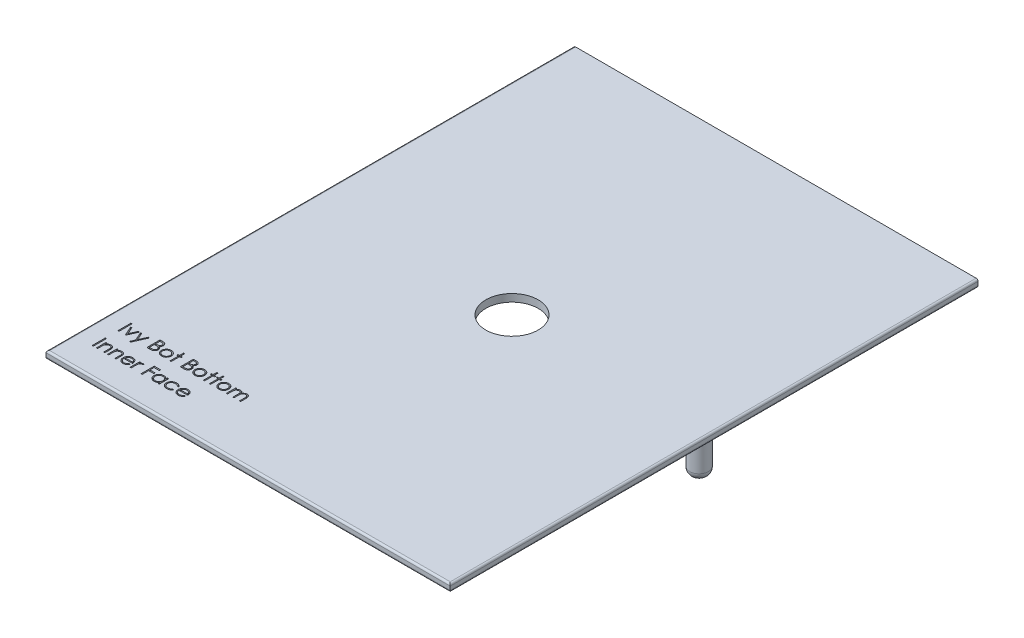
from build123d import *

# Parameters (mm, degrees)
SKETCH1_W           = 108
SKETCH1_H           = 141
BOSS_EXTRUDE1_DEPTH = 2
SKETCH6_R           = 7
CUT_EXTRUDE1_DEPTH  = 89.827079204
FILLET1_R           = 0.5
SKETCH9_W           = 0.314102564
SKETCH9_H           = 3.5
CUT_EXTRUDE4_DEPTH  = 1
CUT_EXTRUDE5_DEPTH  = 1
SKETCH11_R          = 2.5
BOSS_EXTRUDE2_DEPTH = 10
FILLET4_R           = 2


with BuildPart() as part:
    # Sketch1 → Boss-Extrude1 (new body)
    with BuildSketch(Plane(origin=(0, 0, 0), x_dir=(1, 0, 0), z_dir=(0, 1, 0))):
        Rectangle(SKETCH1_W, SKETCH1_H)
    extrude(amount=BOSS_EXTRUDE1_DEPTH)

    # Sketch6 → Cut-Extrude1 (cut, through all)
    with BuildSketch(Plane(origin=(0, 2, 0), x_dir=(1, 0, 0), z_dir=(0, 1, 0))):
        Circle(SKETCH6_R)
    extrude(amount=-CUT_EXTRUDE1_DEPTH, mode=Mode.SUBTRACT)

    # Fillet1
    fillet1_edges = [part.edges().sort_by_distance(p)[0] for p in [
        (-54, 0, 0),
        (0, 0, -70.5),
        (0, 0, 70.5),
        (54, 0, 0),
        (54, 2, 0),
        (-54, 2, 0),
        (0, 2, 70.5),
    ]]
    fillet(fillet1_edges, radius=FILLET1_R)

    # Sketch9 → Cut-Extrude4 (cut)
    # profile 1 of 21: a face of its own
    with BuildSketch(Plane(origin=(0, 2, 0), x_dir=(1, 0, 0), z_dir=(0, 1, 0))):
        with Locations((-48.84313938, -54.561589843)):
            Rectangle(SKETCH9_W, SKETCH9_H)
    # profile 2 of 21: a face of its own
    with BuildSketch(Plane(origin=(0, 2, 0), x_dir=(1, 0, 0), z_dir=(0, 1, 0))):
        Polygon((-48.147626559, -53.753897536), (-47.807582489, -53.753897536), (-46.958523995, -55.616077023), (-46.109465501, -53.753897536), (-45.769421431, -53.753897536), (-46.936088098, -56.311589843), (-46.980959892, -56.311589843), align=None)
    # profile 3 of 21: a face of its own
    with BuildSketch(Plane(origin=(0, 2, 0), x_dir=(1, 0, 0), z_dir=(0, 1, 0))):
        Polygon((-45.500190662, -53.753897536), (-45.161548835, -53.753897536), (-44.295663418, -55.712831831), (-43.416456687, -53.753897536), (-43.077113739, -53.753897536), (-44.647626559, -57.253897536), (-44.986969508, -57.253897536), (-44.466036014, -56.093540965), align=None)
    # profile 4 of 21: a face of its own
    with BuildSketch(Plane(origin=(0, 2, 0), x_dir=(1, 0, 0), z_dir=(0, 1, 0))):
        with BuildLine():
            Line((-41.237370149, -52.811589843), (-40.554477521, -52.811589843))
            add(Edge.make_bspline(
                [(-40.554477521, -52.811589843), (-40.521049042, -52.811765594), (-40.456256332, -52.812106242), (-40.36203689, -52.817389373), (-40.27378808, -52.824593043), (-40.191484307, -52.836023136), (-40.115163605, -52.849814913), (-40.044595968, -52.866516729), (-39.980005795, -52.886543342), (-39.902893059, -52.918389624), (-39.814972398, -52.965712792), (-39.719774005, -53.035641357), (-39.638369766, -53.12117382), (-39.568183449, -53.217656476), (-39.512382329, -53.323792247), (-39.472013032, -53.437051436), (-39.446455157, -53.555973178), (-39.443826722, -53.637616356), (-39.442498354, -53.678877504)],
                knots=[0, 0, 0, 0, 1.001505555, 1.941167018, 2.826882275, 3.653841531, 4.429895133, 5.150066043, 5.825578002, 6.45369114, 7.647487171, 8.808567382, 9.977351308, 11.170798116, 12.373658725, 13.556498008, 14.765093433, 16, 16, 16, 16], degree=3))
            add(Edge.make_bspline(
                [(-39.442498354, -53.678877504), (-39.443591572, -53.717530059), (-39.44573985, -53.793485976), (-39.466282609, -53.904580086), (-39.498443278, -54.010331304), (-39.543148527, -54.11035369), (-39.601250523, -54.202387303), (-39.670108842, -54.287174569), (-39.753185644, -54.361125626), (-39.815428884, -54.402468529), (-39.84704563, -54.42346885)],
                knots=[0, 0, 0, 0, 1.044552857, 2.05264487, 3.044412934, 4.028983338, 5.005914585, 5.980388656, 6.974128949, 8, 8, 8, 8], degree=3))
            add(Edge.make_bspline(
                [(-39.84704563, -54.42346885), (-39.807285202, -54.438733849), (-39.731213655, -54.467939573), (-39.626527642, -54.519575037), (-39.536332797, -54.575737148), (-39.459935651, -54.637068998), (-39.394597996, -54.703177808), (-39.337545055, -54.775032923), (-39.288863681, -54.853571681), (-39.247150757, -54.937975216), (-39.214602001, -55.027381684), (-39.190226097, -55.12095246), (-39.176258648, -55.218352016), (-39.174271006, -55.284637395), (-39.173267585, -55.31810026)],
                knots=[0, 0, 0, 0, 1.27268992, 2.434971085, 3.483601985, 4.442670788, 5.356604649, 6.2567628, 7.179492994, 8.113709626, 9.066344395, 10.018646069, 10.999752585, 12, 12, 12, 12], degree=3))
            add(Edge.make_bspline(
                [(-39.173267585, -55.31810026), (-39.174244431, -55.352267132), (-39.176166403, -55.41949141), (-39.190346375, -55.518246545), (-39.214355481, -55.612621491), (-39.247426628, -55.703226674), (-39.290588942, -55.789886809), (-39.343116907, -55.872700073), (-39.40574847, -55.950834403), (-39.475811339, -56.025158026), (-39.555073485, -56.091985814), (-39.64058924, -56.15150152), (-39.73343556, -56.200447582), (-39.832087554, -56.241563604), (-39.93765187, -56.272970802), (-40.049654477, -56.294943376), (-40.167998779, -56.309748413), (-40.24920853, -56.310965618), (-40.290855726, -56.311589843)],
                knots=[0, 0, 0, 0, 0.978564426, 1.925352924, 2.850884081, 3.763762016, 4.682927383, 5.618979971, 6.567305752, 7.547517671, 8.540179244, 9.531824382, 10.526200242, 11.540722885, 12.589160233, 13.674978461, 14.80764778, 16, 16, 16, 16], degree=3))
            Line((-40.290855726, -56.311589843), (-41.237370149, -56.311589843))
            Line((-41.237370149, -56.311589843), (-41.237370149, -52.811589843))
        make_face()
        with BuildLine():
            Line((-40.923267585, -53.170564202), (-40.923267585, -54.292359074))
            Line((-40.923267585, -54.292359074), (-40.712229925, -54.292359074))
            add(Edge.make_bspline(
                [(-40.712229925, -54.292359074), (-40.681381129, -54.291959151), (-40.62177497, -54.291186418), (-40.535455073, -54.288972901), (-40.455330055, -54.282774858), (-40.381538222, -54.276578596), (-40.314195778, -54.266504008), (-40.253451917, -54.254511885), (-40.19835332, -54.24182898), (-40.134813774, -54.220259493), (-40.062740826, -54.188381818), (-39.985907722, -54.138909982), (-39.918173252, -54.079985629), (-39.860976064, -54.011994667), (-39.814164594, -53.937128481), (-39.781650879, -53.856581601), (-39.759603594, -53.772361469), (-39.757612063, -53.714543216), (-39.756600918, -53.6851876)],
                knots=[0, 0, 0, 0, 1.156816544, 2.235205308, 3.236616184, 4.169592532, 5.011045266, 5.787822928, 6.49130361, 7.128639758, 8.301311294, 9.436451833, 10.541879658, 11.654887649, 12.756523258, 13.837046038, 14.901820046, 16, 16, 16, 16], degree=3))
            add(Edge.make_bspline(
                [(-39.756600918, -53.6851876), (-39.757127098, -53.665761828), (-39.758159258, -53.627656056), (-39.766612561, -53.572106702), (-39.780980135, -53.51986295), (-39.799434428, -53.470208839), (-39.825223117, -53.424696989), (-39.85558658, -53.381753793), (-39.892272271, -53.342841675), (-39.934029583, -53.306472176), (-39.982038206, -53.274227649), (-40.036269498, -53.245986886), (-40.097457175, -53.223246109), (-40.16457003, -53.203329956), (-40.238641118, -53.189341663), (-40.318815671, -53.177688275), (-40.40575039, -53.171755533), (-40.465895493, -53.17097017), (-40.496985533, -53.170564202)],
                knots=[0, 0, 0, 0, 0.91205012, 1.789085906, 2.630437955, 3.453916878, 4.269457761, 5.079663411, 5.91843418, 6.774407191, 7.675494373, 8.627863946, 9.638891023, 10.736472738, 11.911756761, 13.175263542, 14.539845004, 16, 16, 16, 16], degree=3))
            Line((-40.496985533, -53.170564202), (-40.923267585, -53.170564202))
        make_face(mode=Mode.SUBTRACT)
        with BuildLine():
            Line((-40.923267585, -54.651333433), (-40.923267585, -55.952615484))
            Line((-40.923267585, -55.952615484), (-40.47595188, -55.952615484))
            add(Edge.make_bspline(
                [(-40.47595188, -55.952615484), (-40.443932954, -55.952231737), (-40.382220695, -55.951492115), (-40.293119465, -55.94907756), (-40.210536361, -55.943585284), (-40.134848226, -55.934939435), (-40.065237773, -55.925560985), (-40.00254007, -55.912949705), (-39.946246876, -55.898500744), (-39.880972569, -55.876166572), (-39.80746906, -55.841470101), (-39.728258204, -55.789155874), (-39.657831986, -55.726832567), (-39.598026727, -55.654701652), (-39.549013738, -55.576270326), (-39.513358283, -55.493124976), (-39.491367426, -55.406639448), (-39.488705257, -55.347672736), (-39.487370149, -55.31810026)],
                knots=[0, 0, 0, 0, 1.160039823, 2.235823828, 3.228722157, 4.157150951, 4.99529583, 5.772374946, 6.472645482, 7.099169577, 8.269452708, 9.405989375, 10.527446681, 11.663510218, 12.788923519, 13.866172445, 14.929861265, 16, 16, 16, 16], degree=3))
            add(Edge.make_bspline(
                [(-39.487370149, -55.31810026), (-39.487646253, -55.29960692), (-39.488194008, -55.262918538), (-39.496454623, -55.209002719), (-39.508468493, -55.156776845), (-39.523999927, -55.106099105), (-39.546619394, -55.057885728), (-39.573025939, -55.011183169), (-39.603987341, -54.965929689), (-39.652231507, -54.908717436), (-39.722403491, -54.842800423), (-39.822110266, -54.778262921), (-39.935482564, -54.726215114), (-40.017710057, -54.704115637), (-40.060186655, -54.692699619)],
                knots=[0, 0, 0, 0, 0.723448775, 1.435228256, 2.130040452, 2.821711965, 3.505591119, 4.210454504, 4.921174351, 5.648778258, 7.137944449, 8.670945889, 10.280296675, 12, 12, 12, 12], degree=3))
            add(Edge.make_bspline(
                [(-40.060186655, -54.692699619), (-40.077215751, -54.689244535), (-40.114138343, -54.6817532), (-40.174345924, -54.673845497), (-40.243081793, -54.666800437), (-40.32050467, -54.661589279), (-40.406712511, -54.656202736), (-40.50188943, -54.654107915), (-40.605646745, -54.651608655), (-40.677639117, -54.65142752), (-40.715034412, -54.651333433)],
                knots=[0, 0, 0, 0, 0.634451884, 1.375622551, 2.216452059, 3.157844607, 4.20941857, 5.370758133, 6.634282058, 8, 8, 8, 8], degree=3))
            Line((-40.715034412, -54.651333433), (-40.923267585, -54.651333433))
        make_face(mode=Mode.SUBTRACT)
    # profile 5 of 21: a face of its own
    with BuildSketch(Plane(origin=(0, 2, 0), x_dir=(1, 0, 0), z_dir=(0, 1, 0))):
        with BuildLine():
            add(Edge.make_bspline(
                [(-37.309685854, -53.709025741), (-37.261694581, -53.710047632), (-37.167595424, -53.712051311), (-37.029787538, -53.733466276), (-36.898242402, -53.766213641), (-36.77245621, -53.811485203), (-36.654039914, -53.872167153), (-36.54126867, -53.944576445), (-36.434451661, -54.030359038), (-36.370428632, -54.096717106), (-36.337931046, -54.13039994)],
                knots=[0, 0, 0, 0, 1.054011418, 2.066658804, 3.057071809, 4.030435133, 4.997543892, 5.974964718, 6.972108034, 8, 8, 8, 8], degree=3))
            add(Edge.make_bspline(
                [(-36.337931046, -54.13039994), (-36.309949092, -54.162613925), (-36.254526712, -54.226418468), (-36.183460993, -54.329874081), (-36.122239433, -54.437014181), (-36.073176472, -54.549261508), (-36.034491448, -54.665636179), (-36.007025752, -54.78653819), (-35.990688817, -54.911700537), (-35.98848585, -54.996704375), (-35.987370149, -55.039754908)],
                knots=[0, 0, 0, 0, 1.025258237, 2.030674902, 3.01204498, 3.988269485, 4.97094183, 5.956517959, 6.965070386, 8, 8, 8, 8], degree=3))
            add(Edge.make_bspline(
                [(-35.987370149, -55.039754908), (-35.988351486, -55.083054965), (-35.990290654, -55.168617899), (-36.008634271, -55.294637264), (-36.037165357, -55.416832087), (-36.077997195, -55.534690781), (-36.130355304, -55.648573608), (-36.194245992, -55.757983157), (-36.270117609, -55.863135291), (-36.356121606, -55.963137129), (-36.451173482, -56.055303344), (-36.55428963, -56.135631613), (-36.663443664, -56.204453138), (-36.780087017, -56.259889553), (-36.903154504, -56.303599254), (-37.032911572, -56.33429927), (-37.169156642, -56.352860954), (-37.262183864, -56.355244527), (-37.309685854, -56.356461638)],
                knots=[0, 0, 0, 0, 0.998656419, 1.973391657, 2.932242238, 3.890759089, 4.846373663, 5.82037756, 6.809684879, 7.83454468, 8.860553229, 9.859544525, 10.845671541, 11.83227036, 12.833544569, 13.85385346, 14.904124723, 16, 16, 16, 16], degree=3))
            add(Edge.make_bspline(
                [(-37.309685854, -56.356461638), (-37.357420574, -56.355240442), (-37.450911433, -56.352848668), (-37.587637415, -56.334371385), (-37.717627034, -56.303613402), (-37.840855633, -56.25974591), (-37.95800048, -56.204451366), (-38.067786977, -56.135839676), (-38.170986892, -56.055279521), (-38.266058876, -55.963143584), (-38.352057482, -55.863133628), (-38.42793049, -55.757983589), (-38.491820816, -55.648573496), (-38.54417902, -55.534690811), (-38.585010833, -55.416832079), (-38.613541926, -55.294637266), (-38.63188554, -55.168617898), (-38.633824709, -55.083054965), (-38.634806046, -55.039754908)],
                knots=[0, 0, 0, 0, 1.099876186, 2.154163076, 3.173186993, 4.173200201, 5.163417411, 6.152872554, 7.150605724, 8.17532212, 9.198891216, 10.186952605, 11.159729845, 12.11414092, 13.071450619, 14.029093627, 15.002601286, 16, 16, 16, 16], degree=3))
            add(Edge.make_bspline(
                [(-38.634806046, -55.039754908), (-38.633682736, -54.996938362), (-38.631458775, -54.912168959), (-38.615138265, -54.787241899), (-38.587779709, -54.66654451), (-38.549048312, -54.550619034), (-38.499533122, -54.438863597), (-38.439171834, -54.331458766), (-38.367381201, -54.228470966), (-38.31217925, -54.164748886), (-38.284245149, -54.132503305)],
                knots=[0, 0, 0, 0, 1.031353054, 2.041901799, 3.029428768, 4.008703097, 4.981709435, 5.96992636, 6.972712378, 8, 8, 8, 8], degree=3))
            add(Edge.make_bspline(
                [(-38.284245149, -54.132503305), (-38.251796558, -54.098528366), (-38.187980694, -54.031710669), (-38.080631966, -53.946178145), (-37.968138145, -53.872262072), (-37.848413219, -53.812785856), (-37.722730361, -53.765947338), (-37.590511119, -53.733381823), (-37.452235603, -53.712128468), (-37.357675982, -53.71007029), (-37.309685854, -53.709025741)],
                knots=[0, 0, 0, 0, 1.027980169, 2.021703884, 2.998553061, 3.971491411, 4.943284454, 5.930300938, 6.949603206, 8, 8, 8, 8], degree=3))
        make_face()
        with BuildLine():
            add(Edge.make_bspline(
                [(-37.311088098, -54.023128305), (-37.345025709, -54.024092897), (-37.412024838, -54.025997179), (-37.510644422, -54.040481084), (-37.605584576, -54.063428588), (-37.69702542, -54.096032644), (-37.784658593, -54.138131543), (-37.868567995, -54.189839903), (-37.949000435, -54.25047286), (-38.024382498, -54.319935531), (-38.093564811, -54.395814526), (-38.154042787, -54.476662885), (-38.205467894, -54.561169231), (-38.248308053, -54.649421442), (-38.280215241, -54.742313856), (-38.303388263, -54.838794487), (-38.317858504, -54.939059904), (-38.319744882, -55.007220922), (-38.320703482, -55.041858273)],
                knots=[0, 0, 0, 0, 1.021534396, 2.016698045, 2.994645724, 3.958388632, 4.93408049, 5.916473867, 6.921342795, 7.962252576, 8.998418191, 10.008913653, 10.997312074, 11.973003931, 12.956656626, 13.948281152, 14.957379055, 16, 16, 16, 16], degree=3))
            add(Edge.make_bspline(
                [(-38.320703482, -55.041858273), (-38.319096659, -55.0866103), (-38.315907414, -55.175434706), (-38.289972178, -55.306245828), (-38.246585898, -55.43182768), (-38.187998618, -55.551444066), (-38.114592399, -55.662116344), (-38.028105333, -55.760787829), (-37.929465632, -55.84597364), (-37.819849132, -55.916654486), (-37.701494814, -55.972814241), (-37.576238493, -56.012613217), (-37.445597799, -56.03848491), (-37.356317068, -56.041056384), (-37.311088098, -56.042359074)],
                knots=[0, 0, 0, 0, 1.016792936, 2.018143844, 3.017858371, 4.030088057, 5.03801393, 6.028138512, 7.003788237, 7.991172063, 8.984598303, 9.972568034, 10.972917682, 12, 12, 12, 12], degree=3))
            add(Edge.make_bspline(
                [(-37.311088098, -56.042359074), (-37.265861729, -56.041048794), (-37.176586133, -56.038462337), (-37.046126956, -56.012743517), (-36.921212984, -55.972639857), (-36.802981596, -55.916717647), (-36.693414993, -55.845705232), (-36.594065872, -55.761268855), (-36.508317261, -55.661855004), (-36.434983656, -55.551297475), (-36.375436913, -55.432013123), (-36.332253711, -55.30622265), (-36.306256125, -55.175440608), (-36.303075297, -55.086612278), (-36.301472713, -55.041858273)],
                knots=[0, 0, 0, 0, 1.02726834, 2.027799167, 3.010890988, 4.004497153, 4.992059811, 5.971914811, 6.958719428, 7.966827853, 8.981595046, 9.981490638, 10.983022906, 12, 12, 12, 12], degree=3))
            add(Edge.make_bspline(
                [(-36.301472713, -55.041858273), (-36.302430983, -55.007220715), (-36.304316712, -54.93905929), (-36.318791676, -54.838796836), (-36.341947216, -54.742305239), (-36.373918833, -54.649453236), (-36.416572847, -54.560940732), (-36.46898964, -54.476911005), (-36.529220666, -54.395534459), (-36.599237787, -54.320180818), (-36.674541165, -54.250445781), (-36.755006203, -54.189816392), (-36.838791181, -54.138358796), (-36.926169764, -54.095672556), (-37.017622332, -54.063725215), (-37.112429461, -54.040348584), (-37.210628271, -54.026058387), (-37.277387314, -54.024111246), (-37.311088098, -54.023128305)],
                knots=[0, 0, 0, 0, 1.042956736, 2.052379634, 3.044323526, 4.02829302, 5.004299113, 5.996692471, 7.007513377, 8.048758398, 9.090003419, 10.095195979, 11.07790575, 12.047570684, 13.018257071, 13.989683339, 14.985167495, 16, 16, 16, 16], degree=3))
        make_face(mode=Mode.SUBTRACT)
    # profile 6 of 21: a face of its own
    with BuildSketch(Plane(origin=(0, 2, 0), x_dir=(1, 0, 0), z_dir=(0, 1, 0))):
        Polygon((-35.045062457, -52.721846254), (-34.730959892, -52.721846254), (-34.730959892, -53.753897536), (-34.282241944, -53.753897536), (-34.282241944, -54.0680001), (-34.730959892, -54.0680001), (-34.730959892, -56.311589843), (-35.045062457, -56.311589843), (-35.045062457, -54.0680001), (-35.493780405, -54.0680001), (-35.493780405, -53.753897536), (-35.045062457, -53.753897536), align=None)
    # profile 7 of 21: a face of its own
    with BuildSketch(Plane(origin=(0, 2, 0), x_dir=(1, 0, 0), z_dir=(0, 1, 0))):
        with BuildLine():
            Line((-32.307882969, -52.811589843), (-31.624990341, -52.811589843))
            add(Edge.make_bspline(
                [(-31.624990341, -52.811589843), (-31.591561863, -52.811765594), (-31.526769153, -52.812106242), (-31.432549711, -52.817389373), (-31.3443009, -52.824593043), (-31.261997128, -52.836023136), (-31.185676425, -52.849814913), (-31.115108788, -52.866516729), (-31.050518616, -52.886543342), (-30.97340588, -52.918389624), (-30.885485219, -52.965712792), (-30.790286826, -53.035641357), (-30.708882587, -53.12117382), (-30.638696269, -53.217656476), (-30.58289515, -53.323792247), (-30.542525852, -53.437051436), (-30.516967977, -53.555973178), (-30.514339543, -53.637616356), (-30.513011175, -53.678877504)],
                knots=[0, 0, 0, 0, 1.001505555, 1.941167018, 2.826882275, 3.653841531, 4.429895133, 5.150066043, 5.825578002, 6.45369114, 7.647487171, 8.808567382, 9.977351308, 11.170798116, 12.373658725, 13.556498008, 14.765093433, 16, 16, 16, 16], degree=3))
            add(Edge.make_bspline(
                [(-30.513011175, -53.678877504), (-30.514104393, -53.717530059), (-30.51625267, -53.793485976), (-30.53679543, -53.904580086), (-30.568956098, -54.010331304), (-30.613661347, -54.11035369), (-30.671763343, -54.202387303), (-30.740621662, -54.287174569), (-30.823698465, -54.361125626), (-30.885941705, -54.402468529), (-30.91755845, -54.42346885)],
                knots=[0, 0, 0, 0, 1.044552857, 2.05264487, 3.044412934, 4.028983338, 5.005914585, 5.980388656, 6.974128949, 8, 8, 8, 8], degree=3))
            add(Edge.make_bspline(
                [(-30.91755845, -54.42346885), (-30.877798023, -54.438733849), (-30.801726475, -54.467939573), (-30.697040463, -54.519575037), (-30.606845618, -54.575737148), (-30.530448472, -54.637068998), (-30.465110817, -54.703177808), (-30.408057875, -54.775032923), (-30.359376501, -54.853571681), (-30.317663578, -54.937975216), (-30.285114822, -55.027381684), (-30.260738917, -55.12095246), (-30.246771468, -55.218352016), (-30.244783827, -55.284637395), (-30.243780405, -55.31810026)],
                knots=[0, 0, 0, 0, 1.27268992, 2.434971085, 3.483601985, 4.442670788, 5.356604649, 6.2567628, 7.179492994, 8.113709626, 9.066344395, 10.018646069, 10.999752585, 12, 12, 12, 12], degree=3))
            add(Edge.make_bspline(
                [(-30.243780405, -55.31810026), (-30.244757251, -55.352267132), (-30.246679223, -55.41949141), (-30.260859195, -55.518246545), (-30.284868302, -55.612621491), (-30.317939448, -55.703226674), (-30.361101763, -55.789886809), (-30.413629727, -55.872700073), (-30.476261291, -55.950834403), (-30.54632416, -56.025158026), (-30.625586305, -56.091985814), (-30.71110206, -56.15150152), (-30.80394838, -56.200447582), (-30.902600374, -56.241563604), (-31.00816469, -56.272970802), (-31.120167298, -56.294943376), (-31.2385116, -56.309748413), (-31.319721351, -56.310965618), (-31.361368546, -56.311589843)],
                knots=[0, 0, 0, 0, 0.978564426, 1.925352924, 2.850884081, 3.763762016, 4.682927383, 5.618979971, 6.567305752, 7.547517671, 8.540179244, 9.531824382, 10.526200242, 11.540722885, 12.589160233, 13.674978461, 14.80764778, 16, 16, 16, 16], degree=3))
            Line((-31.361368546, -56.311589843), (-32.307882969, -56.311589843))
            Line((-32.307882969, -56.311589843), (-32.307882969, -52.811589843))
        make_face()
        with BuildLine():
            Line((-31.993780405, -53.170564202), (-31.993780405, -54.292359074))
            Line((-31.993780405, -54.292359074), (-31.782742745, -54.292359074))
            add(Edge.make_bspline(
                [(-31.782742745, -54.292359074), (-31.75189395, -54.291959151), (-31.69228779, -54.291186418), (-31.605967894, -54.288972901), (-31.525842876, -54.282774858), (-31.452051043, -54.276578596), (-31.384708599, -54.266504008), (-31.323964737, -54.254511885), (-31.26886614, -54.24182898), (-31.205326595, -54.220259493), (-31.133253646, -54.188381818), (-31.056420542, -54.138909982), (-30.988686072, -54.079985629), (-30.931488885, -54.011994667), (-30.884677414, -53.937128481), (-30.852163699, -53.856581601), (-30.830116415, -53.772361469), (-30.828124883, -53.714543216), (-30.827113739, -53.6851876)],
                knots=[0, 0, 0, 0, 1.156816544, 2.235205308, 3.236616184, 4.169592532, 5.011045266, 5.787822928, 6.49130361, 7.128639758, 8.301311294, 9.436451833, 10.541879658, 11.654887649, 12.756523258, 13.837046038, 14.901820046, 16, 16, 16, 16], degree=3))
            add(Edge.make_bspline(
                [(-30.827113739, -53.6851876), (-30.827639919, -53.665761828), (-30.828672079, -53.627656056), (-30.837125381, -53.572106702), (-30.851492956, -53.51986295), (-30.869947249, -53.470208839), (-30.895735938, -53.424696989), (-30.926099401, -53.381753793), (-30.962785091, -53.342841675), (-31.004542404, -53.306472176), (-31.052551027, -53.274227649), (-31.106782319, -53.245986886), (-31.167969996, -53.223246109), (-31.235082851, -53.203329956), (-31.309153938, -53.189341663), (-31.389328492, -53.177688275), (-31.476263211, -53.171755533), (-31.536408313, -53.17097017), (-31.567498354, -53.170564202)],
                knots=[0, 0, 0, 0, 0.91205012, 1.789085906, 2.630437955, 3.453916878, 4.269457761, 5.079663411, 5.91843418, 6.774407191, 7.675494373, 8.627863946, 9.638891023, 10.736472738, 11.911756761, 13.175263542, 14.539845004, 16, 16, 16, 16], degree=3))
            Line((-31.567498354, -53.170564202), (-31.993780405, -53.170564202))
        make_face(mode=Mode.SUBTRACT)
        with BuildLine():
            Line((-31.993780405, -54.651333433), (-31.993780405, -55.952615484))
            Line((-31.993780405, -55.952615484), (-31.5464647, -55.952615484))
            add(Edge.make_bspline(
                [(-31.5464647, -55.952615484), (-31.514445774, -55.952231737), (-31.452733516, -55.951492115), (-31.363632286, -55.94907756), (-31.281049182, -55.943585284), (-31.205361046, -55.934939435), (-31.135750593, -55.925560985), (-31.07305289, -55.912949705), (-31.016759697, -55.898500744), (-30.951485389, -55.876166572), (-30.877981881, -55.841470101), (-30.798771024, -55.789155874), (-30.728344806, -55.726832567), (-30.668539547, -55.654701652), (-30.619526559, -55.576270326), (-30.583871104, -55.493124976), (-30.561880247, -55.406639448), (-30.559218077, -55.347672736), (-30.557882969, -55.31810026)],
                knots=[0, 0, 0, 0, 1.160039823, 2.235823828, 3.228722157, 4.157150951, 4.99529583, 5.772374946, 6.472645482, 7.099169577, 8.269452708, 9.405989375, 10.527446681, 11.663510218, 12.788923519, 13.866172445, 14.929861265, 16, 16, 16, 16], degree=3))
            add(Edge.make_bspline(
                [(-30.557882969, -55.31810026), (-30.558159074, -55.29960692), (-30.558706829, -55.262918538), (-30.566967444, -55.209002719), (-30.578981314, -55.156776845), (-30.594512747, -55.106099105), (-30.617132215, -55.057885728), (-30.64353876, -55.011183169), (-30.674500161, -54.965929689), (-30.722744327, -54.908717436), (-30.792916312, -54.842800423), (-30.892623087, -54.778262921), (-31.005995385, -54.726215114), (-31.088222878, -54.704115637), (-31.130699476, -54.692699619)],
                knots=[0, 0, 0, 0, 0.723448775, 1.435228256, 2.130040452, 2.821711965, 3.505591119, 4.210454504, 4.921174351, 5.648778258, 7.137944449, 8.670945889, 10.280296675, 12, 12, 12, 12], degree=3))
            add(Edge.make_bspline(
                [(-31.130699476, -54.692699619), (-31.147728572, -54.689244535), (-31.184651164, -54.6817532), (-31.244858744, -54.673845497), (-31.313594613, -54.666800437), (-31.391017491, -54.661589279), (-31.477225332, -54.656202736), (-31.57240225, -54.654107915), (-31.676159565, -54.651608655), (-31.748151937, -54.65142752), (-31.785547232, -54.651333433)],
                knots=[0, 0, 0, 0, 0.634451884, 1.375622551, 2.216452059, 3.157844607, 4.20941857, 5.370758133, 6.634282058, 8, 8, 8, 8], degree=3))
            Line((-31.785547232, -54.651333433), (-31.993780405, -54.651333433))
        make_face(mode=Mode.SUBTRACT)
    # profile 8 of 21: a face of its own
    with BuildSketch(Plane(origin=(0, 2, 0), x_dir=(1, 0, 0), z_dir=(0, 1, 0))):
        with BuildLine():
            add(Edge.make_bspline(
                [(-28.380198675, -53.709025741), (-28.332207402, -53.710047632), (-28.238108244, -53.712051311), (-28.100300358, -53.733466276), (-27.968755222, -53.766213641), (-27.84296903, -53.811485203), (-27.724552735, -53.872167153), (-27.611781491, -53.944576445), (-27.504964482, -54.030359038), (-27.440941452, -54.096717106), (-27.408443867, -54.13039994)],
                knots=[0, 0, 0, 0, 1.054011418, 2.066658804, 3.057071809, 4.030435133, 4.997543892, 5.974964718, 6.972108034, 8, 8, 8, 8], degree=3))
            add(Edge.make_bspline(
                [(-27.408443867, -54.13039994), (-27.380461913, -54.162613925), (-27.325039533, -54.226418468), (-27.253973814, -54.329874081), (-27.192752254, -54.437014181), (-27.143689293, -54.549261508), (-27.105004269, -54.665636179), (-27.077538573, -54.78653819), (-27.061201638, -54.911700537), (-27.058998671, -54.996704375), (-27.057882969, -55.039754908)],
                knots=[0, 0, 0, 0, 1.025258237, 2.030674902, 3.01204498, 3.988269485, 4.97094183, 5.956517959, 6.965070386, 8, 8, 8, 8], degree=3))
            add(Edge.make_bspline(
                [(-27.057882969, -55.039754908), (-27.058864307, -55.083054965), (-27.060803475, -55.168617899), (-27.079147091, -55.294637264), (-27.107678177, -55.416832087), (-27.148510015, -55.534690781), (-27.200868125, -55.648573608), (-27.264758812, -55.757983157), (-27.340630429, -55.863135291), (-27.426634426, -55.963137129), (-27.521686302, -56.055303344), (-27.624802451, -56.135631613), (-27.733956484, -56.204453138), (-27.850599838, -56.259889553), (-27.973667324, -56.303599254), (-28.103424393, -56.33429927), (-28.239669463, -56.352860954), (-28.332696684, -56.355244527), (-28.380198675, -56.356461638)],
                knots=[0, 0, 0, 0, 0.998656419, 1.973391657, 2.932242238, 3.890759089, 4.846373663, 5.82037756, 6.809684879, 7.83454468, 8.860553229, 9.859544525, 10.845671541, 11.83227036, 12.833544569, 13.85385346, 14.904124723, 16, 16, 16, 16], degree=3))
            add(Edge.make_bspline(
                [(-28.380198675, -56.356461638), (-28.427933394, -56.355240442), (-28.521424254, -56.352848668), (-28.658150236, -56.334371385), (-28.788139855, -56.303613402), (-28.911368453, -56.25974591), (-29.0285133, -56.204451366), (-29.138299797, -56.135839676), (-29.241499713, -56.055279521), (-29.336571697, -55.963143584), (-29.422570302, -55.863133628), (-29.498443311, -55.757983589), (-29.562333637, -55.648573496), (-29.614691841, -55.534690811), (-29.655523654, -55.416832079), (-29.684054746, -55.294637266), (-29.702398361, -55.168617898), (-29.704337529, -55.083054965), (-29.705318867, -55.039754908)],
                knots=[0, 0, 0, 0, 1.099876186, 2.154163076, 3.173186993, 4.173200201, 5.163417411, 6.152872554, 7.150605724, 8.17532212, 9.198891216, 10.186952605, 11.159729845, 12.11414092, 13.071450619, 14.029093627, 15.002601286, 16, 16, 16, 16], degree=3))
            add(Edge.make_bspline(
                [(-29.705318867, -55.039754908), (-29.704195556, -54.996938362), (-29.701971595, -54.912168959), (-29.685651086, -54.787241899), (-29.658292529, -54.66654451), (-29.619561133, -54.550619034), (-29.570045942, -54.438863597), (-29.509684654, -54.331458766), (-29.437894022, -54.228470966), (-29.38269207, -54.164748886), (-29.354757969, -54.132503305)],
                knots=[0, 0, 0, 0, 1.031353054, 2.041901799, 3.029428768, 4.008703097, 4.981709435, 5.96992636, 6.972712378, 8, 8, 8, 8], degree=3))
            add(Edge.make_bspline(
                [(-29.354757969, -54.132503305), (-29.322309378, -54.098528366), (-29.258493515, -54.031710669), (-29.151144787, -53.946178145), (-29.038650966, -53.872262072), (-28.91892604, -53.812785856), (-28.793243182, -53.765947338), (-28.661023939, -53.733381823), (-28.522748424, -53.712128468), (-28.428188802, -53.71007029), (-28.380198675, -53.709025741)],
                knots=[0, 0, 0, 0, 1.027980169, 2.021703884, 2.998553061, 3.971491411, 4.943284454, 5.930300938, 6.949603206, 8, 8, 8, 8], degree=3))
        make_face()
        with BuildLine():
            add(Edge.make_bspline(
                [(-28.381600918, -54.023128305), (-28.415538529, -54.024092897), (-28.482537658, -54.025997179), (-28.581157243, -54.040481084), (-28.676097397, -54.063428588), (-28.767538241, -54.096032644), (-28.855171413, -54.138131543), (-28.939080816, -54.189839903), (-29.019513256, -54.25047286), (-29.094895319, -54.319935531), (-29.164077631, -54.395814526), (-29.224555608, -54.476662885), (-29.275980714, -54.561169231), (-29.318820873, -54.649421442), (-29.350728061, -54.742313856), (-29.373901084, -54.838794487), (-29.388371324, -54.939059904), (-29.390257703, -55.007220922), (-29.391216303, -55.041858273)],
                knots=[0, 0, 0, 0, 1.021534396, 2.016698045, 2.994645724, 3.958388632, 4.93408049, 5.916473867, 6.921342795, 7.962252576, 8.998418191, 10.008913653, 10.997312074, 11.973003931, 12.956656626, 13.948281152, 14.957379055, 16, 16, 16, 16], degree=3))
            add(Edge.make_bspline(
                [(-29.391216303, -55.041858273), (-29.389609479, -55.0866103), (-29.386420235, -55.175434706), (-29.360484998, -55.306245828), (-29.317098718, -55.43182768), (-29.258511439, -55.551444066), (-29.18510522, -55.662116344), (-29.098618153, -55.760787829), (-28.999978453, -55.84597364), (-28.890361953, -55.916654486), (-28.772007635, -55.972814241), (-28.646751314, -56.012613217), (-28.51611062, -56.03848491), (-28.426829888, -56.041056384), (-28.381600918, -56.042359074)],
                knots=[0, 0, 0, 0, 1.016792936, 2.018143844, 3.017858371, 4.030088057, 5.03801393, 6.028138512, 7.003788237, 7.991172063, 8.984598303, 9.972568034, 10.972917682, 12, 12, 12, 12], degree=3))
            add(Edge.make_bspline(
                [(-28.381600918, -56.042359074), (-28.336374549, -56.041048794), (-28.247098953, -56.038462337), (-28.116639776, -56.012743517), (-27.991725804, -55.972639857), (-27.873494417, -55.916717647), (-27.763927814, -55.845705232), (-27.664578692, -55.761268855), (-27.578830081, -55.661855004), (-27.505496476, -55.551297475), (-27.445949733, -55.432013123), (-27.402766532, -55.30622265), (-27.376768946, -55.175440608), (-27.373588117, -55.086612278), (-27.371985533, -55.041858273)],
                knots=[0, 0, 0, 0, 1.02726834, 2.027799167, 3.010890988, 4.004497153, 4.992059811, 5.971914811, 6.958719428, 7.966827853, 8.981595046, 9.981490638, 10.983022906, 12, 12, 12, 12], degree=3))
            add(Edge.make_bspline(
                [(-27.371985533, -55.041858273), (-27.372943804, -55.007220715), (-27.374829533, -54.93905929), (-27.389304497, -54.838796836), (-27.412460037, -54.742305239), (-27.444431654, -54.649453236), (-27.487085668, -54.560940732), (-27.539502461, -54.476911005), (-27.599733486, -54.395534459), (-27.669750607, -54.320180818), (-27.745053985, -54.250445781), (-27.825519023, -54.189816392), (-27.909304002, -54.138358796), (-27.996682584, -54.095672556), (-28.088135152, -54.063725215), (-28.182942281, -54.040348584), (-28.281141091, -54.026058387), (-28.347900134, -54.024111246), (-28.381600918, -54.023128305)],
                knots=[0, 0, 0, 0, 1.042956736, 2.052379634, 3.044323526, 4.02829302, 5.004299113, 5.996692471, 7.007513377, 8.048758398, 9.090003419, 10.095195979, 11.07790575, 12.047570684, 13.018257071, 13.989683339, 14.985167495, 16, 16, 16, 16], degree=3))
        make_face(mode=Mode.SUBTRACT)
    # profile 9 of 21: a face of its own
    with BuildSketch(Plane(origin=(0, 2, 0), x_dir=(1, 0, 0), z_dir=(0, 1, 0))):
        Polygon((-26.115575277, -52.721846254), (-25.801472713, -52.721846254), (-25.801472713, -53.753897536), (-25.352754764, -53.753897536), (-25.352754764, -54.0680001), (-25.801472713, -54.0680001), (-25.801472713, -56.311589843), (-26.115575277, -56.311589843), (-26.115575277, -54.0680001), (-26.564293226, -54.0680001), (-26.564293226, -53.753897536), (-26.115575277, -53.753897536), align=None)
    # profile 10 of 21: a face of its own
    with BuildSketch(Plane(origin=(0, 2, 0), x_dir=(1, 0, 0), z_dir=(0, 1, 0))):
        Polygon((-24.500190662, -52.721846254), (-24.186088098, -52.721846254), (-24.186088098, -53.753897536), (-23.737370149, -53.753897536), (-23.737370149, -54.0680001), (-24.186088098, -54.0680001), (-24.186088098, -56.311589843), (-24.500190662, -56.311589843), (-24.500190662, -54.0680001), (-24.94890861, -54.0680001), (-24.94890861, -53.753897536), (-24.500190662, -53.753897536), align=None)
    # profile 11 of 21: a face of its own
    with BuildSketch(Plane(origin=(0, 2, 0), x_dir=(1, 0, 0), z_dir=(0, 1, 0))):
        with BuildLine():
            add(Edge.make_bspline(
                [(-21.963532008, -53.709025741), (-21.915540735, -53.710047632), (-21.821441577, -53.712051311), (-21.683633692, -53.733466276), (-21.552088556, -53.766213641), (-21.426302363, -53.811485203), (-21.307886068, -53.872167153), (-21.195114824, -53.944576445), (-21.088297815, -54.030359038), (-21.024274786, -54.096717106), (-20.9917772, -54.13039994)],
                knots=[0, 0, 0, 0, 1.054011418, 2.066658804, 3.057071809, 4.030435133, 4.997543892, 5.974964718, 6.972108034, 8, 8, 8, 8], degree=3))
            add(Edge.make_bspline(
                [(-20.9917772, -54.13039994), (-20.963795246, -54.162613925), (-20.908372866, -54.226418468), (-20.837307147, -54.329874081), (-20.776085587, -54.437014181), (-20.727022626, -54.549261508), (-20.688337602, -54.665636179), (-20.660871906, -54.78653819), (-20.644534971, -54.911700537), (-20.642332004, -54.996704375), (-20.641216303, -55.039754908)],
                knots=[0, 0, 0, 0, 1.025258237, 2.030674902, 3.01204498, 3.988269485, 4.97094183, 5.956517959, 6.965070386, 8, 8, 8, 8], degree=3))
            add(Edge.make_bspline(
                [(-20.641216303, -55.039754908), (-20.64219764, -55.083054965), (-20.644136808, -55.168617899), (-20.662480425, -55.294637264), (-20.691011511, -55.416832087), (-20.731843349, -55.534690781), (-20.784201458, -55.648573608), (-20.848092146, -55.757983157), (-20.923963763, -55.863135291), (-21.009967759, -55.963137129), (-21.105019636, -56.055303344), (-21.208135784, -56.135631613), (-21.317289818, -56.204453138), (-21.433933171, -56.259889553), (-21.557000658, -56.303599254), (-21.686757726, -56.33429927), (-21.823002796, -56.352860954), (-21.916030018, -56.355244527), (-21.963532008, -56.356461638)],
                knots=[0, 0, 0, 0, 0.998656419, 1.973391657, 2.932242238, 3.890759089, 4.846373663, 5.82037756, 6.809684879, 7.83454468, 8.860553229, 9.859544525, 10.845671541, 11.83227036, 12.833544569, 13.85385346, 14.904124723, 16, 16, 16, 16], degree=3))
            add(Edge.make_bspline(
                [(-21.963532008, -56.356461638), (-22.011266727, -56.355240442), (-22.104757587, -56.352848668), (-22.241483569, -56.334371385), (-22.371473188, -56.303613402), (-22.494701786, -56.25974591), (-22.611846633, -56.204451366), (-22.72163313, -56.135839676), (-22.824833046, -56.055279521), (-22.91990503, -55.963143584), (-23.005903636, -55.863133628), (-23.081776644, -55.757983589), (-23.14566697, -55.648573496), (-23.198025174, -55.534690811), (-23.238856987, -55.416832079), (-23.26738808, -55.294637266), (-23.285731694, -55.168617898), (-23.287670863, -55.083054965), (-23.2886522, -55.039754908)],
                knots=[0, 0, 0, 0, 1.099876186, 2.154163076, 3.173186993, 4.173200201, 5.163417411, 6.152872554, 7.150605724, 8.17532212, 9.198891216, 10.186952605, 11.159729845, 12.11414092, 13.071450619, 14.029093627, 15.002601286, 16, 16, 16, 16], degree=3))
            add(Edge.make_bspline(
                [(-23.2886522, -55.039754908), (-23.28752889, -54.996938362), (-23.285304928, -54.912168959), (-23.268984419, -54.787241899), (-23.241625863, -54.66654451), (-23.202894466, -54.550619034), (-23.153379275, -54.438863597), (-23.093017988, -54.331458766), (-23.021227355, -54.228470966), (-22.966025403, -54.164748886), (-22.938091303, -54.132503305)],
                knots=[0, 0, 0, 0, 1.031353054, 2.041901799, 3.029428768, 4.008703097, 4.981709435, 5.96992636, 6.972712378, 8, 8, 8, 8], degree=3))
            add(Edge.make_bspline(
                [(-22.938091303, -54.132503305), (-22.905642712, -54.098528366), (-22.841826848, -54.031710669), (-22.73447812, -53.946178145), (-22.621984299, -53.872262072), (-22.502259373, -53.812785856), (-22.376576515, -53.765947338), (-22.244357272, -53.733381823), (-22.106081757, -53.712128468), (-22.011522136, -53.71007029), (-21.963532008, -53.709025741)],
                knots=[0, 0, 0, 0, 1.027980169, 2.021703884, 2.998553061, 3.971491411, 4.943284454, 5.930300938, 6.949603206, 8, 8, 8, 8], degree=3))
        make_face()
        with BuildLine():
            add(Edge.make_bspline(
                [(-21.964934251, -54.023128305), (-21.998871863, -54.024092897), (-22.065870991, -54.025997179), (-22.164490576, -54.040481084), (-22.25943073, -54.063428588), (-22.350871574, -54.096032644), (-22.438504747, -54.138131543), (-22.522414149, -54.189839903), (-22.602846589, -54.25047286), (-22.678228652, -54.319935531), (-22.747410964, -54.395814526), (-22.807888941, -54.476662885), (-22.859314047, -54.561169231), (-22.902154206, -54.649421442), (-22.934061394, -54.742313856), (-22.957234417, -54.838794487), (-22.971704657, -54.939059904), (-22.973591036, -55.007220922), (-22.974549636, -55.041858273)],
                knots=[0, 0, 0, 0, 1.021534396, 2.016698045, 2.994645724, 3.958388632, 4.93408049, 5.916473867, 6.921342795, 7.962252576, 8.998418191, 10.008913653, 10.997312074, 11.973003931, 12.956656626, 13.948281152, 14.957379055, 16, 16, 16, 16], degree=3))
            add(Edge.make_bspline(
                [(-22.974549636, -55.041858273), (-22.972942812, -55.0866103), (-22.969753568, -55.175434706), (-22.943818332, -55.306245828), (-22.900432052, -55.43182768), (-22.841844772, -55.551444066), (-22.768438553, -55.662116344), (-22.681951487, -55.760787829), (-22.583311786, -55.84597364), (-22.473695286, -55.916654486), (-22.355340968, -55.972814241), (-22.230084647, -56.012613217), (-22.099443953, -56.03848491), (-22.010163222, -56.041056384), (-21.964934251, -56.042359074)],
                knots=[0, 0, 0, 0, 1.016792936, 2.018143844, 3.017858371, 4.030088057, 5.03801393, 6.028138512, 7.003788237, 7.991172063, 8.984598303, 9.972568034, 10.972917682, 12, 12, 12, 12], degree=3))
            add(Edge.make_bspline(
                [(-21.964934251, -56.042359074), (-21.919707883, -56.041048794), (-21.830432287, -56.038462337), (-21.69997311, -56.012743517), (-21.575059138, -55.972639857), (-21.45682775, -55.916717647), (-21.347261147, -55.845705232), (-21.247912026, -55.761268855), (-21.162163414, -55.661855004), (-21.08882981, -55.551297475), (-21.029283067, -55.432013123), (-20.986099865, -55.30622265), (-20.960102279, -55.175440608), (-20.95692145, -55.086612278), (-20.955318867, -55.041858273)],
                knots=[0, 0, 0, 0, 1.02726834, 2.027799167, 3.010890988, 4.004497153, 4.992059811, 5.971914811, 6.958719428, 7.966827853, 8.981595046, 9.981490638, 10.983022906, 12, 12, 12, 12], degree=3))
            add(Edge.make_bspline(
                [(-20.955318867, -55.041858273), (-20.956277137, -55.007220715), (-20.958162866, -54.93905929), (-20.97263783, -54.838796836), (-20.99579337, -54.742305239), (-21.027764987, -54.649453236), (-21.070419001, -54.560940732), (-21.122835794, -54.476911005), (-21.18306682, -54.395534459), (-21.25308394, -54.320180818), (-21.328387318, -54.250445781), (-21.408852357, -54.189816392), (-21.492637335, -54.138358796), (-21.580015918, -54.095672556), (-21.671468485, -54.063725215), (-21.766275615, -54.040348584), (-21.864474425, -54.026058387), (-21.931233468, -54.024111246), (-21.964934251, -54.023128305)],
                knots=[0, 0, 0, 0, 1.042956736, 2.052379634, 3.044323526, 4.02829302, 5.004299113, 5.996692471, 7.007513377, 8.048758398, 9.090003419, 10.095195979, 11.07790575, 12.047570684, 13.018257071, 13.989683339, 14.985167495, 16, 16, 16, 16], degree=3))
        make_face(mode=Mode.SUBTRACT)
    # profile 12 of 21: a face of its own
    with BuildSketch(Plane(origin=(0, 2, 0), x_dir=(1, 0, 0), z_dir=(0, 1, 0))):
        with BuildLine():
            Line((-20.013011175, -53.753897536), (-19.69890861, -53.753897536))
            Line((-19.69890861, -53.753897536), (-19.69890861, -54.198408754))
            add(Edge.make_bspline(
                [(-19.69890861, -54.198408754), (-19.67062466, -54.159521152), (-19.616429901, -54.085008779), (-19.527564248, -53.986818495), (-19.438788136, -53.90349034), (-19.374854754, -53.859747468), (-19.344140982, -53.838733273)],
                knots=[0, 0, 0, 0, 1.134379233, 2.173579362, 3.122582517, 4, 4, 4, 4], degree=3))
            add(Edge.make_bspline(
                [(-19.344140982, -53.838733273), (-19.30227632, -53.818727908), (-19.21927842, -53.779066694), (-19.087859195, -53.738833135), (-18.953384526, -53.714108034), (-18.862576312, -53.710726661), (-18.816897392, -53.709025741)],
                knots=[0, 0, 0, 0, 1.014936303, 2.012140481, 3.000054389, 4, 4, 4, 4], degree=3))
            add(Edge.make_bspline(
                [(-18.816897392, -53.709025741), (-18.786004396, -53.710071032), (-18.724868817, -53.712139606), (-18.634284727, -53.725599641), (-18.546426115, -53.748865814), (-18.461812086, -53.781273138), (-18.382091406, -53.820519825), (-18.309002209, -53.866569533), (-18.243378, -53.918266608), (-18.185251949, -53.977945541), (-18.132982924, -54.04728214), (-18.084904077, -54.128146389), (-18.040478865, -54.22235405), (-18.015857556, -54.290720591), (-18.002894989, -54.326714042)],
                knots=[0, 0, 0, 0, 1.009824226, 1.998387844, 2.986035974, 3.974953746, 4.955485308, 5.885931332, 6.793869504, 7.679848016, 8.601185859, 9.625726857, 10.749998409, 12, 12, 12, 12], degree=3))
            add(Edge.make_bspline(
                [(-18.002894989, -54.326714042), (-17.989183737, -54.301989623), (-17.96220192, -54.253335438), (-17.916896283, -54.184477176), (-17.869428487, -54.120070384), (-17.819393994, -54.060063959), (-17.766969407, -54.004754229), (-17.711908006, -53.953958327), (-17.654523225, -53.907458114), (-17.574730985, -53.853134954), (-17.470918378, -53.795433773), (-17.340030263, -53.745405329), (-17.203880091, -53.7144892), (-17.111462393, -53.710858928), (-17.064794027, -53.709025741)],
                knots=[0, 0, 0, 0, 0.86119277, 1.694706429, 2.50939023, 3.298075842, 4.073795165, 4.829715201, 5.57930267, 6.321991688, 7.768977793, 9.186738141, 10.579381044, 12, 12, 12, 12], degree=3))
            add(Edge.make_bspline(
                [(-17.064794027, -53.709025741), (-17.021912564, -53.710642962), (-16.937989378, -53.71380802), (-16.815812112, -53.738661493), (-16.701870307, -53.78133914), (-16.596393231, -53.839572777), (-16.501233417, -53.91275196), (-16.418517108, -53.999820798), (-16.348746745, -54.100163421), (-16.303168105, -54.19455541), (-16.272252841, -54.277890742), (-16.253191607, -54.348897034), (-16.236351912, -54.427048587), (-16.222370666, -54.512438848), (-16.212152114, -54.605369456), (-16.204581399, -54.705688332), (-16.199457325, -54.813473444), (-16.199095253, -54.887838944), (-16.19890861, -54.926173177)],
                knots=[0, 0, 0, 0, 1.209669288, 2.367440248, 3.500751976, 4.631527125, 5.755587489, 6.87532382, 8.007944318, 9.190864318, 9.82315674, 10.514484317, 11.263564316, 12.079023757, 12.955305781, 13.901327259, 14.918167583, 16, 16, 16, 16], degree=3))
            Line((-16.19890861, -54.926173177), (-16.19890861, -56.311589843))
            Line((-16.19890861, -56.311589843), (-16.513011175, -56.311589843))
            Line((-16.513011175, -56.311589843), (-16.513011175, -54.924770933))
            add(Edge.make_bspline(
                [(-16.513011175, -54.924770933), (-16.513089057, -54.892050359), (-16.513238737, -54.829166392), (-16.515932368, -54.738913941), (-16.521007682, -54.656645584), (-16.526942321, -54.582473496), (-16.53518613, -54.516224707), (-16.545832062, -54.458032289), (-16.557109742, -54.407438477), (-16.575845733, -54.35135243), (-16.605793625, -54.289482219), (-16.651411105, -54.222758643), (-16.708881211, -54.164677843), (-16.775241368, -54.114259526), (-16.850789812, -54.073265885), (-16.934054536, -54.043989876), (-17.024518587, -54.025866997), (-17.087141376, -54.024060982), (-17.119481527, -54.023128305)],
                knots=[0, 0, 0, 0, 1.253487763, 2.409012846, 3.458416907, 4.410876679, 5.259312806, 6.014470957, 6.676830364, 7.243083969, 8.276244668, 9.299465089, 10.325150304, 11.392391894, 12.482080715, 13.603491619, 14.762376348, 16, 16, 16, 16], degree=3))
            add(Edge.make_bspline(
                [(-17.119481527, -54.023128305), (-17.159151481, -54.024544462), (-17.237554393, -54.027343328), (-17.351999879, -54.055917201), (-17.461970895, -54.098997451), (-17.564186028, -54.161429908), (-17.658213819, -54.236238272), (-17.739113397, -54.325187868), (-17.805945582, -54.425817795), (-17.851199558, -54.518964497), (-17.87978886, -54.602633941), (-17.898665775, -54.675731313), (-17.913349167, -54.758812881), (-17.927119696, -54.851320372), (-17.936107424, -54.953890552), (-17.944275796, -55.066048953), (-17.948096659, -55.188132913), (-17.948631118, -55.272759601), (-17.94890861, -55.316698016)],
                knots=[0, 0, 0, 0, 1.090531906, 2.155305635, 3.229839962, 4.33261226, 5.44038871, 6.529323825, 7.629011124, 8.757537029, 9.370236727, 10.061839251, 10.834451254, 11.692844982, 12.636905849, 13.66920014, 14.789842145, 16, 16, 16, 16], degree=3))
            Line((-17.94890861, -55.316698016), (-17.94890861, -56.311589843))
            Line((-17.94890861, -56.311589843), (-18.263011175, -56.311589843))
            Line((-18.263011175, -56.311589843), (-18.263011175, -55.011008914))
            add(Edge.make_bspline(
                [(-18.263011175, -55.011008914), (-18.263090605, -54.974315595), (-18.263243423, -54.903721338), (-18.26591974, -54.802487663), (-18.271006362, -54.710406583), (-18.27688691, -54.627585119), (-18.285347089, -54.55417379), (-18.294956851, -54.489779032), (-18.306305461, -54.434562281), (-18.325095346, -54.373998896), (-18.353809814, -54.307277973), (-18.399998076, -54.236136952), (-18.457605657, -54.173868854), (-18.525176532, -54.120710106), (-18.601182215, -54.076768625), (-18.685165615, -54.045108873), (-18.776370528, -54.026684583), (-18.839248234, -54.024336087), (-18.871584892, -54.023128305)],
                knots=[0, 0, 0, 0, 1.320475261, 2.540461679, 3.643808994, 4.639130445, 5.527981419, 6.302341397, 6.981980563, 7.553956391, 8.582137848, 9.585246428, 10.591171744, 11.620968678, 12.668337649, 13.738356861, 14.836885341, 16, 16, 16, 16], degree=3))
            add(Edge.make_bspline(
                [(-18.871584892, -54.023128305), (-18.909601104, -54.024658765), (-18.985366063, -54.027708917), (-19.096668033, -54.055163191), (-19.204153717, -54.098167266), (-19.306108415, -54.157827085), (-19.399782564, -54.231726164), (-19.481790831, -54.318641059), (-19.550733357, -54.417490093), (-19.596465171, -54.50965461), (-19.625963646, -54.591227884), (-19.64555898, -54.660578832), (-19.662398606, -54.73757908), (-19.674912628, -54.822466191), (-19.686993043, -54.914687286), (-19.692823352, -55.014701775), (-19.698494915, -55.122423863), (-19.698767329, -55.196796408), (-19.69890861, -55.235367888)],
                knots=[0, 0, 0, 0, 1.098833095, 2.189935336, 3.297829714, 4.440610912, 5.596351641, 6.740013378, 7.886572111, 9.072425424, 9.705826452, 10.395263256, 11.156850408, 11.985370555, 12.878090359, 13.847760091, 14.883794034, 16, 16, 16, 16], degree=3))
            Line((-19.69890861, -55.235367888), (-19.69890861, -56.311589843))
            Line((-19.69890861, -56.311589843), (-20.013011175, -56.311589843))
            Line((-20.013011175, -56.311589843), (-20.013011175, -53.753897536))
        make_face()
    # profile 13 of 21: a face of its own
    with BuildSketch(Plane(origin=(0, 2, 0), x_dir=(1, 0, 0), z_dir=(0, 1, 0))):
        with Locations((-48.84313938, -61.394923177)):
            Rectangle(SKETCH9_W, SKETCH9_H)
    # profile 14 of 21: a face of its own
    with BuildSketch(Plane(origin=(0, 2, 0), x_dir=(1, 0, 0), z_dir=(0, 1, 0))):
        with BuildLine():
            Line((-47.87839579, -60.587230869), (-47.564293226, -60.587230869))
            Line((-47.564293226, -60.587230869), (-47.564293226, -61.04856901))
            add(Edge.make_bspline(
                [(-47.564293226, -61.04856901), (-47.530755591, -61.006726287), (-47.46567464, -60.925529024), (-47.357290306, -60.818808449), (-47.242746406, -60.730863224), (-47.122744403, -60.66075943), (-46.997121392, -60.607912804), (-46.866643122, -60.569746873), (-46.730528416, -60.546862044), (-46.63796398, -60.543871814), (-46.591136175, -60.542359074)],
                knots=[0, 0, 0, 0, 1.12780773, 2.188550248, 3.19190651, 4.159438251, 5.104880172, 6.052711206, 7.014878035, 8, 8, 8, 8], degree=3))
            add(Edge.make_bspline(
                [(-46.591136175, -60.542359074), (-46.54380554, -60.54410427), (-46.451168073, -60.547520038), (-46.316290011, -60.574536729), (-46.190316618, -60.620681984), (-46.073697062, -60.683894055), (-45.968569848, -60.762500528), (-45.876244997, -60.85407831), (-45.79988175, -60.959414393), (-45.748684387, -61.057137549), (-45.714958739, -61.143826344), (-45.693726401, -61.218073094), (-45.67569542, -61.300791245), (-45.660063672, -61.391730834), (-45.64948656, -61.491529024), (-45.641144268, -61.599776716), (-45.635165574, -61.716438847), (-45.634928367, -61.797125474), (-45.634806046, -61.838733273)],
                knots=[0, 0, 0, 0, 1.235846778, 2.418850247, 3.575807741, 4.728682307, 5.871620074, 6.994088408, 8.11269785, 9.256955736, 9.865816715, 10.540099792, 11.271859618, 12.076849838, 12.949306005, 13.892391288, 14.913166135, 16, 16, 16, 16], degree=3))
            Line((-45.634806046, -61.838733273), (-45.634806046, -63.144923177))
            Line((-45.634806046, -63.144923177), (-45.94890861, -63.144923177))
            Line((-45.94890861, -63.144923177), (-45.94890861, -61.941798177))
            add(Edge.make_bspline(
                [(-45.94890861, -61.941798177), (-45.949101818, -61.906975732), (-45.949471392, -61.840366321), (-45.950637039, -61.744997298), (-45.953446846, -61.658510719), (-45.957395159, -61.581113352), (-45.963174189, -61.512879515), (-45.969196821, -61.453670239), (-45.976561797, -61.403560696), (-45.983124711, -61.373395614), (-45.986068066, -61.359867087)],
                knots=[0, 0, 0, 0, 1.430800155, 2.736877192, 3.918605307, 4.986035426, 5.920637409, 6.731861385, 7.431261377, 8, 8, 8, 8], degree=3))
            add(Edge.make_bspline(
                [(-45.986068066, -61.359867087), (-45.996693597, -61.320155902), (-46.017144458, -61.243724157), (-46.067678441, -61.140049805), (-46.131492622, -61.051851617), (-46.209390471, -60.979674895), (-46.300619547, -60.923504059), (-46.404926689, -60.884530104), (-46.52130533, -60.860153835), (-46.603159713, -60.857726703), (-46.645823675, -60.856461638)],
                knots=[0, 0, 0, 0, 1.084156227, 2.086665306, 3.027808233, 3.945421172, 4.874247719, 5.839848303, 6.874090471, 8, 8, 8, 8], degree=3))
            add(Edge.make_bspline(
                [(-46.645823675, -60.856461638), (-46.671091358, -60.856937643), (-46.721095451, -60.857879644), (-46.795245423, -60.867330942), (-46.867169596, -60.882789398), (-46.937589805, -60.903658035), (-47.005097599, -60.932320304), (-47.07186189, -60.964849674), (-47.135368654, -61.005397886), (-47.196972051, -61.050588508), (-47.254284859, -61.100667715), (-47.307613197, -61.153512225), (-47.355151218, -61.209787829), (-47.398219893, -61.268587777), (-47.435398156, -61.330719615), (-47.467851244, -61.395583921), (-47.495386939, -61.46326607), (-47.509069632, -61.510241131), (-47.515915822, -61.533745292)],
                knots=[0, 0, 0, 0, 1.023777757, 2.026029729, 3.023749952, 4.003683103, 4.997618607, 5.993177895, 7.010360494, 8.046726602, 9.087585522, 10.09234134, 11.086953743, 12.070360549, 13.043493632, 14.017870808, 15.008233677, 16, 16, 16, 16], degree=3))
            add(Edge.make_bspline(
                [(-47.515915822, -61.533745292), (-47.519855471, -61.551000495), (-47.528431879, -61.58856417), (-47.537695059, -61.650208589), (-47.546102635, -61.721518564), (-47.553139593, -61.802410881), (-47.55744501, -61.893168756), (-47.562139407, -61.993404594), (-47.563848468, -62.103518082), (-47.564140822, -62.180179775), (-47.564293226, -62.220143529)],
                knots=[0, 0, 0, 0, 0.615963638, 1.340920617, 2.168419149, 3.115676021, 4.16674242, 5.331190069, 6.6087489, 8, 8, 8, 8], degree=3))
            Line((-47.564293226, -62.220143529), (-47.564293226, -63.144923177))
            Line((-47.564293226, -63.144923177), (-47.87839579, -63.144923177))
            Line((-47.87839579, -63.144923177), (-47.87839579, -60.587230869))
        make_face()
    # profile 15 of 21: a face of its own
    with BuildSketch(Plane(origin=(0, 2, 0), x_dir=(1, 0, 0), z_dir=(0, 1, 0))):
        with BuildLine():
            Line((-44.916857328, -60.587230869), (-44.602754764, -60.587230869))
            Line((-44.602754764, -60.587230869), (-44.602754764, -61.04856901))
            add(Edge.make_bspline(
                [(-44.602754764, -61.04856901), (-44.569217129, -61.006726287), (-44.504136178, -60.925529024), (-44.395751845, -60.818808449), (-44.281207944, -60.730863224), (-44.161205941, -60.66075943), (-44.035582931, -60.607912804), (-43.905104661, -60.569746873), (-43.768989955, -60.546862044), (-43.676425518, -60.543871814), (-43.629597713, -60.542359074)],
                knots=[0, 0, 0, 0, 1.12780773, 2.188550248, 3.19190651, 4.159438251, 5.104880172, 6.052711206, 7.014878035, 8, 8, 8, 8], degree=3))
            add(Edge.make_bspline(
                [(-43.629597713, -60.542359074), (-43.582267079, -60.54410427), (-43.489629611, -60.547520038), (-43.35475155, -60.574536729), (-43.228778156, -60.620681984), (-43.1121586, -60.683894055), (-43.007031387, -60.762500528), (-42.914706535, -60.85407831), (-42.838343288, -60.959414393), (-42.787145925, -61.057137549), (-42.753420277, -61.143826344), (-42.73218794, -61.218073094), (-42.714156958, -61.300791245), (-42.69852521, -61.391730834), (-42.687948098, -61.491529024), (-42.679605807, -61.599776716), (-42.673627113, -61.716438847), (-42.673389906, -61.797125474), (-42.673267585, -61.838733273)],
                knots=[0, 0, 0, 0, 1.235846778, 2.418850247, 3.575807741, 4.728682307, 5.871620074, 6.994088408, 8.11269785, 9.256955736, 9.865816715, 10.540099792, 11.271859618, 12.076849838, 12.949306005, 13.892391288, 14.913166135, 16, 16, 16, 16], degree=3))
            Line((-42.673267585, -61.838733273), (-42.673267585, -63.144923177))
            Line((-42.673267585, -63.144923177), (-42.987370149, -63.144923177))
            Line((-42.987370149, -63.144923177), (-42.987370149, -61.941798177))
            add(Edge.make_bspline(
                [(-42.987370149, -61.941798177), (-42.987563357, -61.906975732), (-42.987932931, -61.840366321), (-42.989098578, -61.744997298), (-42.991908384, -61.658510719), (-42.995856697, -61.581113352), (-43.001635728, -61.512879515), (-43.007658359, -61.453670239), (-43.015023336, -61.403560696), (-43.021586249, -61.373395614), (-43.024529604, -61.359867087)],
                knots=[0, 0, 0, 0, 1.430800155, 2.736877192, 3.918605307, 4.986035426, 5.920637409, 6.731861385, 7.431261377, 8, 8, 8, 8], degree=3))
            add(Edge.make_bspline(
                [(-43.024529604, -61.359867087), (-43.035155136, -61.320155902), (-43.055605996, -61.243724157), (-43.106139979, -61.140049805), (-43.16995416, -61.051851617), (-43.247852009, -60.979674895), (-43.339081085, -60.923504059), (-43.443388228, -60.884530104), (-43.559766869, -60.860153835), (-43.641621251, -60.857726703), (-43.684285213, -60.856461638)],
                knots=[0, 0, 0, 0, 1.084156227, 2.086665306, 3.027808233, 3.945421172, 4.874247719, 5.839848303, 6.874090471, 8, 8, 8, 8], degree=3))
            add(Edge.make_bspline(
                [(-43.684285213, -60.856461638), (-43.709552897, -60.856937643), (-43.75955699, -60.857879644), (-43.833706961, -60.867330942), (-43.905631135, -60.882789398), (-43.976051344, -60.903658035), (-44.043559137, -60.932320304), (-44.110323429, -60.964849674), (-44.173830193, -61.005397886), (-44.23543359, -61.050588508), (-44.292746397, -61.100667715), (-44.346074736, -61.153512225), (-44.393612756, -61.209787829), (-44.436681431, -61.268587777), (-44.473859695, -61.330719615), (-44.506312783, -61.395583921), (-44.533848478, -61.46326607), (-44.54753117, -61.510241131), (-44.55437736, -61.533745292)],
                knots=[0, 0, 0, 0, 1.023777757, 2.026029729, 3.023749952, 4.003683103, 4.997618607, 5.993177895, 7.010360494, 8.046726602, 9.087585522, 10.09234134, 11.086953743, 12.070360549, 13.043493632, 14.017870808, 15.008233677, 16, 16, 16, 16], degree=3))
            add(Edge.make_bspline(
                [(-44.55437736, -61.533745292), (-44.558317009, -61.551000495), (-44.566893418, -61.58856417), (-44.576156598, -61.650208589), (-44.584564173, -61.721518564), (-44.591601132, -61.802410881), (-44.595906548, -61.893168756), (-44.600600945, -61.993404594), (-44.602310006, -62.103518082), (-44.60260236, -62.180179775), (-44.602754764, -62.220143529)],
                knots=[0, 0, 0, 0, 0.615963638, 1.340920617, 2.168419149, 3.115676021, 4.16674242, 5.331190069, 6.6087489, 8, 8, 8, 8], degree=3))
            Line((-44.602754764, -62.220143529), (-44.602754764, -63.144923177))
            Line((-44.602754764, -63.144923177), (-44.916857328, -63.144923177))
            Line((-44.916857328, -63.144923177), (-44.916857328, -60.587230869))
        make_face()
    # profile 16 of 21: a face of its own
    with BuildSketch(Plane(origin=(0, 2, 0), x_dir=(1, 0, 0), z_dir=(0, 1, 0))):
        with BuildLine():
            Line((-39.856160213, -62.337230869), (-39.577113739, -62.483765324))
            add(Edge.make_bspline(
                [(-39.577113739, -62.483765324), (-39.599350334, -62.523208655), (-39.642613942, -62.599949758), (-39.71701469, -62.705381619), (-39.795006763, -62.800229335), (-39.880110731, -62.881958989), (-39.96978041, -62.953210374), (-40.064513065, -63.015548199), (-40.164801882, -63.068666719), (-40.270651607, -63.113419247), (-40.382951158, -63.147828741), (-40.501972675, -63.172132962), (-40.62794417, -63.18715623), (-40.71429035, -63.188901371), (-40.758503963, -63.189794972)],
                knots=[0, 0, 0, 0, 1.120438281, 2.179929193, 3.190490725, 4.156257408, 5.095198341, 6.022838206, 6.959905092, 7.901321166, 8.864066838, 9.862729781, 10.905609505, 12, 12, 12, 12], degree=3))
            add(Edge.make_bspline(
                [(-40.758503963, -63.189794972), (-40.807645941, -63.188647796), (-40.903507702, -63.18640999), (-41.043047449, -63.167117525), (-41.174426868, -63.135645166), (-41.297638571, -63.091679625), (-41.412380824, -63.034252301), (-41.518881678, -62.964292819), (-41.617701204, -62.882160564), (-41.705725413, -62.787144121), (-41.784969296, -62.685462164), (-41.854895116, -62.579506279), (-41.913352547, -62.469543055), (-41.960905157, -62.356272531), (-41.999310022, -62.240408637), (-42.026076726, -62.120897169), (-42.041506474, -61.998061585), (-42.04387092, -61.91496425), (-42.045062457, -61.873088241)],
                knots=[0, 0, 0, 0, 1.145258523, 2.234067595, 3.276747158, 4.290159414, 5.277019952, 6.260822364, 7.254936242, 8.264827045, 9.274100331, 10.257902744, 11.220704747, 12.172965371, 13.118907548, 14.062713208, 15.023725156, 16, 16, 16, 16], degree=3))
            add(Edge.make_bspline(
                [(-42.045062457, -61.873088241), (-42.044003315, -61.83379341), (-42.041904237, -61.755916246), (-42.02867345, -61.640650701), (-42.005225157, -61.528622249), (-41.973048833, -61.419737801), (-41.931497586, -61.314179667), (-41.880665367, -61.211883603), (-41.820472989, -61.112958463), (-41.774000316, -61.05055533), (-41.750591303, -61.019121895)],
                knots=[0, 0, 0, 0, 1.024358464, 2.0301432, 3.019427413, 4.004406732, 4.986367066, 5.972626655, 6.978780325, 8, 8, 8, 8], degree=3))
            add(Edge.make_bspline(
                [(-41.750591303, -61.019121895), (-41.71888362, -60.981253025), (-41.656472673, -60.906714874), (-41.550916318, -60.808776548), (-41.436616122, -60.726732773), (-41.315004496, -60.658725637), (-41.184668021, -60.60705199), (-41.04735873, -60.568544408), (-40.901513144, -60.546966397), (-40.801807923, -60.543918563), (-40.750791623, -60.542359074)],
                knots=[0, 0, 0, 0, 1.030682036, 2.02871468, 2.997146059, 3.962720338, 4.930598197, 5.918074684, 6.934738563, 8, 8, 8, 8], degree=3))
            add(Edge.make_bspline(
                [(-40.750791623, -60.542359074), (-40.698344018, -60.543713123), (-40.595453772, -60.546369458), (-40.445421651, -60.570995792), (-40.303460934, -60.610048346), (-40.16962843, -60.665202137), (-40.043910569, -60.736361689), (-39.92712452, -60.82450353), (-39.817273007, -60.926921617), (-39.753364428, -61.005684827), (-39.720843707, -61.045764523)],
                knots=[0, 0, 0, 0, 1.056321875, 2.072262726, 3.055038591, 4.01806755, 4.982017516, 5.957941055, 6.960871419, 8, 8, 8, 8], degree=3))
            add(Edge.make_bspline(
                [(-39.720843707, -61.045764523), (-39.698716768, -61.075968104), (-39.654610175, -61.136174223), (-39.599363075, -61.23434538), (-39.55140568, -61.337055974), (-39.513072719, -61.445966272), (-39.482033218, -61.559785852), (-39.459576399, -61.679328396), (-39.446406781, -61.804558308), (-39.443818083, -61.889884863), (-39.442498354, -61.933384715)],
                knots=[0, 0, 0, 0, 0.94817472, 1.890038105, 2.849395472, 3.817997239, 4.812318967, 5.836947057, 6.897266129, 8, 8, 8, 8], degree=3))
            Line((-39.442498354, -61.933384715), (-41.730959892, -61.933384715))
            add(Edge.make_bspline(
                [(-41.730959892, -61.933384715), (-41.729420286, -61.967085179), (-41.726392712, -62.033355783), (-41.712277569, -62.130326566), (-41.690028795, -62.222699908), (-41.658759733, -62.30978295), (-41.620892887, -62.392713078), (-41.57450717, -62.470875115), (-41.519167617, -62.543913045), (-41.457441917, -62.612480183), (-41.388734822, -62.673540944), (-41.316452075, -62.72819272), (-41.23955851, -62.773998317), (-41.158660426, -62.811178206), (-41.073888641, -62.840284522), (-40.985216446, -62.860152343), (-40.892818329, -62.87345945), (-40.829832595, -62.874939115), (-40.797766783, -62.875692408)],
                knots=[0, 0, 0, 0, 1.094153842, 2.151609401, 3.174256925, 4.172055639, 5.149267565, 6.128595816, 7.11444997, 8.118368179, 9.117203808, 10.09244225, 11.054858984, 12.015122123, 12.976791628, 13.957293641, 14.960065497, 16, 16, 16, 16], degree=3))
            add(Edge.make_bspline(
                [(-40.797766783, -62.875692408), (-40.766415636, -62.875084351), (-40.704208945, -62.87387785), (-40.611568088, -62.862145939), (-40.52042856, -62.843175663), (-40.431167577, -62.817285673), (-40.345596731, -62.785708821), (-40.266351181, -62.747605963), (-40.193470965, -62.705456217), (-40.125353999, -62.657246542), (-40.059283005, -62.598238355), (-39.993740519, -62.524602634), (-39.923463866, -62.437515106), (-39.879474273, -62.37196944), (-39.856160213, -62.337230869)],
                knots=[0, 0, 0, 0, 0.99110716, 1.966546729, 2.947904876, 3.932708344, 4.903319531, 5.828989031, 6.710028674, 7.56322171, 8.463672341, 9.504779593, 10.677557249, 12, 12, 12, 12], degree=3))
        make_face()
        with BuildLine():
            add(Edge.make_bspline(
                [(-39.756600918, -61.619282151), (-39.768097543, -61.577619277), (-39.790224844, -61.497431657), (-39.836461209, -61.386390766), (-39.888532749, -61.287702865), (-39.950154481, -61.202123232), (-40.019973206, -61.126119719), (-40.100618389, -61.059701134), (-40.191054282, -61.000283683), (-40.290813423, -60.950131184), (-40.396455208, -60.907441325), (-40.5070614, -60.878816209), (-40.619919188, -60.859206667), (-40.696253474, -60.857380558), (-40.734665822, -60.856461638)],
                knots=[0, 0, 0, 0, 1.154881502, 2.222775134, 3.210006277, 4.132804581, 5.035138423, 5.962687519, 6.919655026, 7.923214229, 8.944639381, 9.960483929, 10.97369054, 12, 12, 12, 12], degree=3))
            add(Edge.make_bspline(
                [(-40.734665822, -60.856461638), (-40.76601526, -60.85707331), (-40.82798651, -60.858282456), (-40.919287578, -60.869752585), (-41.006967277, -60.88871243), (-41.091672564, -60.914677387), (-41.172293433, -60.949285989), (-41.250488201, -60.989869216), (-41.324268597, -61.0394108), (-41.370409893, -61.077169654), (-41.393720309, -61.096245292)],
                knots=[0, 0, 0, 0, 1.04873581, 2.073130211, 3.073294108, 4.04793562, 5.032784715, 6.005352987, 6.992311501, 8, 8, 8, 8], degree=3))
            add(Edge.make_bspline(
                [(-41.393720309, -61.096245292), (-41.410413591, -61.111339608), (-41.444196725, -61.141886824), (-41.489337247, -61.19451603), (-41.532557719, -61.251267593), (-41.571891372, -61.314312717), (-41.607968959, -61.382933496), (-41.641728936, -61.456551131), (-41.672115348, -61.535724262), (-41.689211458, -61.590896701), (-41.698007168, -61.619282151)],
                knots=[0, 0, 0, 0, 0.879870761, 1.780643979, 2.707998968, 3.669668524, 4.684282772, 5.740141944, 6.837334558, 8, 8, 8, 8], degree=3))
            Line((-41.698007168, -61.619282151), (-39.756600918, -61.619282151))
        make_face(mode=Mode.SUBTRACT)
    # profile 17 of 21: a face of its own
    with BuildSketch(Plane(origin=(0, 2, 0), x_dir=(1, 0, 0), z_dir=(0, 1, 0))):
        with BuildLine():
            Line((-38.904036816, -60.587230869), (-38.589934251, -60.587230869))
            Line((-38.589934251, -60.587230869), (-38.589934251, -60.963733273))
            add(Edge.make_bspline(
                [(-38.589934251, -60.963733273), (-38.566745493, -60.928677445), (-38.522397172, -60.861633445), (-38.448684242, -60.772964144), (-38.373180911, -60.699549098), (-38.295525724, -60.641045579), (-38.215147624, -60.59723246), (-38.133810672, -60.565139425), (-38.050235202, -60.54616211), (-37.994073278, -60.543628451), (-37.965935854, -60.542359074)],
                knots=[0, 0, 0, 0, 1.2804753, 2.448899062, 3.506932113, 4.484331642, 5.4025378, 6.288909075, 7.142734305, 8, 8, 8, 8], degree=3))
            add(Edge.make_bspline(
                [(-37.965935854, -60.542359074), (-37.944109528, -60.543549601), (-37.899200442, -60.545999187), (-37.831217853, -60.563210011), (-37.761174401, -60.590688034), (-37.716032013, -60.616528256), (-37.692498354, -60.629999299)],
                knots=[0, 0, 0, 0, 0.901110191, 1.854092781, 2.881294221, 4, 4, 4, 4], degree=3))
            Line((-37.692498354, -60.629999299), (-37.864974316, -60.902034555))
            add(Edge.make_bspline(
                [(-37.864974316, -60.902034555), (-37.880083337, -60.895294289), (-37.908763151, -60.882499973), (-37.950717717, -60.867357963), (-37.989399054, -60.858442047), (-38.014042613, -60.85709133), (-38.025531207, -60.856461638)],
                knots=[0, 0, 0, 0, 1.180555205, 2.24091978, 3.179933427, 4, 4, 4, 4], degree=3))
            add(Edge.make_bspline(
                [(-38.025531207, -60.856461638), (-38.05073694, -60.858141676), (-38.10214933, -60.861568465), (-38.177633829, -60.888507273), (-38.250881035, -60.932032513), (-38.309052697, -60.980303625), (-38.35409495, -61.026851422), (-38.386235176, -61.067499825), (-38.415717923, -61.113078456), (-38.443888143, -61.16280814), (-38.469554437, -61.217537986), (-38.493509106, -61.276721199), (-38.515167969, -61.340426328), (-38.527518214, -61.384808848), (-38.533844508, -61.407543369)],
                knots=[0, 0, 0, 0, 1.125678352, 2.296057538, 3.5422874, 4.923748041, 5.663163013, 6.437101912, 7.23742474, 8.08941207, 8.991984279, 9.93940061, 10.944477711, 12, 12, 12, 12], degree=3))
            add(Edge.make_bspline(
                [(-38.533844508, -61.407543369), (-38.538576901, -61.427820543), (-38.549058793, -61.472732941), (-38.559250331, -61.548081466), (-38.569319849, -61.637105125), (-38.576416467, -61.740051718), (-38.582994509, -61.856664162), (-38.586704591, -61.987120107), (-38.589807732, -62.131553458), (-38.589890799, -62.232527812), (-38.589934251, -62.285347856)],
                knots=[0, 0, 0, 0, 0.566838948, 1.255505196, 2.06880316, 3.007127437, 4.065329342, 5.249902469, 6.561414163, 8, 8, 8, 8], degree=3))
            Line((-38.589934251, -62.285347856), (-38.589934251, -63.144923177))
            Line((-38.589934251, -63.144923177), (-38.904036816, -63.144923177))
            Line((-38.904036816, -63.144923177), (-38.904036816, -60.587230869))
        make_face()
    # profile 18 of 21: a face of its own
    with BuildSketch(Plane(origin=(0, 2, 0), x_dir=(1, 0, 0), z_dir=(0, 1, 0))):
        Polygon((-35.942498354, -59.644923177), (-34.237370149, -59.644923177), (-34.237370149, -60.003897536), (-35.62839579, -60.003897536), (-35.62839579, -61.080820613), (-34.237370149, -61.080820613), (-34.237370149, -61.439794972), (-35.62839579, -61.439794972), (-35.62839579, -63.144923177), (-35.942498354, -63.144923177), align=None)
    # profile 19 of 21: a face of its own
    with BuildSketch(Plane(origin=(0, 2, 0), x_dir=(1, 0, 0), z_dir=(0, 1, 0))):
        with BuildLine():
            Line((-31.096344508, -60.587230869), (-31.096344508, -63.144923177))
            Line((-31.096344508, -63.144923177), (-31.410447072, -63.144923177))
            Line((-31.410447072, -63.144923177), (-31.410447072, -62.702515324))
            add(Edge.make_bspline(
                [(-31.410447072, -62.702515324), (-31.445865863, -62.742554918), (-31.514986078, -62.820692689), (-31.630427196, -62.922774862), (-31.752795374, -63.007153183), (-31.881496695, -63.075303099), (-32.016414938, -63.126495155), (-32.157251025, -63.162881314), (-32.304062406, -63.18627515), (-32.404314761, -63.188611171), (-32.455118546, -63.189794972)],
                knots=[0, 0, 0, 0, 1.074387032, 2.096679803, 3.090159297, 4.057316773, 5.018401886, 5.985159533, 6.978961417, 8, 8, 8, 8], degree=3))
            add(Edge.make_bspline(
                [(-32.455118546, -63.189794972), (-32.5002865, -63.188568599), (-32.589359705, -63.186150139), (-32.720388782, -63.167387835), (-32.846481032, -63.137257214), (-32.967755604, -63.095356324), (-33.08342775, -63.039775503), (-33.194487846, -62.973234255), (-33.300360538, -62.893993424), (-33.399432077, -62.803405396), (-33.490664078, -62.705010409), (-33.57072535, -62.600064862), (-33.63747843, -62.489022558), (-33.693298511, -62.373289404), (-33.736294855, -62.251974485), (-33.76626849, -62.125497317), (-33.785008936, -61.994007443), (-33.787426397, -61.90446792), (-33.7886522, -61.859065805)],
                knots=[0, 0, 0, 0, 1.033919861, 2.038935746, 3.024066025, 3.998881131, 4.97069526, 5.957263378, 6.95902576, 7.993208707, 9.027059324, 10.027763471, 11.009749337, 11.988697705, 12.965288445, 13.950418724, 14.960734635, 16, 16, 16, 16], degree=3))
            add(Edge.make_bspline(
                [(-33.7886522, -61.859065805), (-33.787399229, -61.814602101), (-33.784922172, -61.726699758), (-33.766468952, -61.59742106), (-33.735437943, -61.472902799), (-33.691890096, -61.353545856), (-33.636048141, -61.239205806), (-33.568120054, -61.129801781), (-33.488100929, -61.025032383), (-33.395848522, -60.927361157), (-33.295913752, -60.837140542), (-33.189005021, -60.758731497), (-33.07778174, -60.691014648), (-32.960518729, -60.637361172), (-32.838951624, -60.593952067), (-32.711998179, -60.563919099), (-32.5801866, -60.546221778), (-32.490696108, -60.543659014), (-32.445302841, -60.542359074)],
                knots=[0, 0, 0, 0, 1.020392517, 2.01726096, 2.990465484, 3.961182959, 4.928053699, 5.906110375, 6.912531644, 7.948652711, 8.985773172, 9.998621852, 10.987621588, 11.969261332, 12.953316658, 13.946091881, 14.958173133, 16, 16, 16, 16], degree=3))
            add(Edge.make_bspline(
                [(-32.445302841, -60.542359074), (-32.393102982, -60.543796826), (-32.290741522, -60.546616189), (-32.141013513, -60.570078916), (-31.999369035, -60.609717383), (-31.864714683, -60.663634881), (-31.737533997, -60.73528361), (-31.619031013, -60.825663571), (-31.507965529, -60.934204758), (-31.443585238, -61.017575203), (-31.410447072, -61.060488081)],
                knots=[0, 0, 0, 0, 1.038897134, 2.037228247, 3.008116434, 3.962042015, 4.918381754, 5.904844433, 6.921570401, 8, 8, 8, 8], degree=3))
            Line((-31.410447072, -61.060488081), (-31.410447072, -60.587230869))
            Line((-31.410447072, -60.587230869), (-31.096344508, -60.587230869))
        make_face()
        with BuildLine():
            add(Edge.make_bspline(
                [(-32.44109611, -60.856461638), (-32.487010448, -60.858095276), (-32.577638048, -60.861319817), (-32.71068205, -60.886493312), (-32.837995464, -60.928377907), (-32.958941539, -60.985659808), (-33.071609755, -61.057688544), (-33.172303426, -61.144809928), (-33.261846127, -61.244646942), (-33.337154392, -61.356749052), (-33.398544889, -61.476927143), (-33.441711921, -61.602551581), (-33.470181168, -61.731356559), (-33.473089689, -61.818719245), (-33.474549636, -61.862571414)],
                knots=[0, 0, 0, 0, 1.031046209, 2.035121221, 3.029706178, 4.034933723, 5.034054252, 6.02443088, 7.017295772, 8.038157696, 9.050218397, 10.03989886, 11.016116709, 12, 12, 12, 12], degree=3))
            add(Edge.make_bspline(
                [(-33.474549636, -61.862571414), (-33.472684743, -61.906161521), (-33.468962266, -61.993170877), (-33.442211571, -62.122151454), (-33.397331698, -62.247805496), (-33.336089635, -62.369066489), (-33.259403011, -62.48165059), (-33.170514358, -62.583390712), (-33.068564077, -62.670880301), (-32.95563657, -62.744117874), (-32.835028599, -62.803280395), (-32.708194668, -62.844446035), (-32.57751903, -62.871023815), (-32.488666696, -62.874128292), (-32.443900598, -62.875692408)],
                knots=[0, 0, 0, 0, 0.979072187, 1.954306742, 2.945804271, 3.96968567, 4.997920485, 5.998718438, 6.996577872, 8.005894225, 9.015743152, 10.005417472, 10.995077863, 12, 12, 12, 12], degree=3))
            add(Edge.make_bspline(
                [(-32.443900598, -62.875692408), (-32.398454095, -62.874032444), (-32.308065508, -62.87073094), (-32.1746268, -62.845449675), (-32.045131838, -62.803680876), (-31.921344609, -62.74578175), (-31.806028478, -62.674024394), (-31.7025306, -62.590017303), (-31.615014632, -62.492314119), (-31.540822023, -62.384937666), (-31.482646606, -62.267225669), (-31.440270547, -62.141891478), (-31.415216641, -62.00893073), (-31.412058911, -61.918066803), (-31.410447072, -61.871685997)],
                knots=[0, 0, 0, 0, 1.01762866, 2.023962475, 3.030623092, 4.058876274, 5.077231937, 6.066672613, 7.034107872, 8.005628644, 8.981990164, 9.965428785, 10.961468474, 12, 12, 12, 12], degree=3))
            add(Edge.make_bspline(
                [(-31.410447072, -61.871685997), (-31.411406728, -61.836348167), (-31.413295636, -61.766792133), (-31.427726205, -61.664664616), (-31.450681132, -61.56693089), (-31.483027302, -61.473488201), (-31.525518586, -61.384853185), (-31.576766352, -61.300389425), (-31.637671802, -61.220536214), (-31.707254498, -61.146393143), (-31.7834197, -61.078766681), (-31.864014241, -61.01840244), (-31.949992988, -60.968813667), (-32.039910025, -60.927772396), (-32.133921359, -60.895113246), (-32.232791979, -60.873325552), (-32.335470966, -60.858365231), (-32.405517022, -60.85710285), (-32.44109611, -60.856461638)],
                knots=[0, 0, 0, 0, 1.050140795, 2.067009409, 3.05949893, 4.030605086, 5.00011959, 5.97591094, 6.962425594, 7.979863591, 8.993523472, 9.986985069, 10.967611495, 11.937549037, 12.921786183, 13.919465291, 14.943216303, 16, 16, 16, 16], degree=3))
        make_face(mode=Mode.SUBTRACT)
    # profile 20 of 21: a face of its own
    with BuildSketch(Plane(origin=(0, 2, 0), x_dir=(1, 0, 0), z_dir=(0, 1, 0))):
        with BuildLine():
            Line((-27.865575277, -61.141818209), (-28.12849595, -61.305179587))
            add(Edge.make_bspline(
                [(-28.12849595, -61.305179587), (-28.157325816, -61.269351193), (-28.214072511, -61.198829083), (-28.312611747, -61.10781915), (-28.417623161, -61.029652108), (-28.530901209, -60.965948357), (-28.652287009, -60.916726907), (-28.78130186, -60.881896701), (-28.917927365, -60.860192458), (-29.011592564, -60.857725621), (-29.059585694, -60.856461638)],
                knots=[0, 0, 0, 0, 1.026593902, 2.0206758, 2.988051866, 3.946915611, 4.916868779, 5.907761954, 6.927957743, 8, 8, 8, 8], degree=3))
            add(Edge.make_bspline(
                [(-29.059585694, -60.856461638), (-29.097944651, -60.85751848), (-29.173491573, -60.859599902), (-29.284397727, -60.872610396), (-29.39004008, -60.896252404), (-29.491080789, -60.927403361), (-29.586801207, -60.969153651), (-29.677452126, -61.019963407), (-29.763837616, -61.079013447), (-29.843454357, -61.147423993), (-29.916283364, -61.22182266), (-29.979382278, -61.301576356), (-30.034319211, -61.384296247), (-30.077425168, -61.472047989), (-30.112700338, -61.562824042), (-30.135907058, -61.658337898), (-30.151371754, -61.757365906), (-30.153141082, -61.824884245), (-30.154036816, -61.859065805)],
                knots=[0, 0, 0, 0, 1.112346261, 2.190735716, 3.231507886, 4.247384806, 5.251966152, 6.253067467, 7.256802811, 8.280671706, 9.291813951, 10.270744147, 11.225547591, 12.165006084, 13.100104208, 14.043489273, 15.009504848, 16, 16, 16, 16], degree=3))
            add(Edge.make_bspline(
                [(-30.154036816, -61.859065805), (-30.152257563, -61.903835016), (-30.148723033, -61.992770212), (-30.121021573, -62.124048314), (-30.075677166, -62.250972004), (-30.013619315, -62.372640141), (-29.935142181, -62.485234296), (-29.842969617, -62.586217751), (-29.737050534, -62.673633779), (-29.618318203, -62.746106304), (-29.48956046, -62.804367672), (-29.352170355, -62.845875004), (-29.207270575, -62.870927377), (-29.108063828, -62.87408332), (-29.057482328, -62.875692408)],
                knots=[0, 0, 0, 0, 0.966302908, 1.919585723, 2.883856336, 3.870342332, 4.860282998, 5.839159637, 6.814385684, 7.815993281, 8.834850808, 9.858348828, 10.908058873, 12, 12, 12, 12], degree=3))
            add(Edge.make_bspline(
                [(-29.057482328, -62.875692408), (-29.011127144, -62.87439291), (-28.920026906, -62.871839053), (-28.78685962, -62.85031009), (-28.66007971, -62.815066457), (-28.539691679, -62.765918807), (-28.425915513, -62.702391291), (-28.319486338, -62.62403212), (-28.2182864, -62.533095519), (-28.158789423, -62.462777548), (-28.12849595, -62.426974459)],
                knots=[0, 0, 0, 0, 1.039848629, 2.043578496, 3.018386758, 3.987534228, 4.954977003, 5.934852016, 6.948509513, 8, 8, 8, 8], degree=3))
            Line((-28.12849595, -62.426974459), (-27.865575277, -62.59945042))
            add(Edge.make_bspline(
                [(-27.865575277, -62.59945042), (-27.881162979, -62.622341147), (-27.912286646, -62.668046624), (-27.964314272, -62.732490741), (-28.020434103, -62.792812423), (-28.0804272, -62.848930813), (-28.14351021, -62.902188832), (-28.21183812, -62.950040407), (-28.283207731, -62.995175229), (-28.358456889, -63.035788102), (-28.436807587, -63.072294423), (-28.518149576, -63.103685594), (-28.602129389, -63.1306557), (-28.688845765, -63.152093047), (-28.778469664, -63.169203885), (-28.870769298, -63.180557587), (-28.96571288, -63.189032868), (-29.029885031, -63.189538735), (-29.062390181, -63.189794972)],
                knots=[0, 0, 0, 0, 0.954134338, 1.905101784, 2.851144739, 3.791306361, 4.734911809, 5.6936923, 6.663572882, 7.643865596, 8.638447847, 9.640600242, 10.646758161, 11.676244097, 12.717260333, 13.78922464, 14.880174919, 16, 16, 16, 16], degree=3))
            add(Edge.make_bspline(
                [(-29.062390181, -63.189794972), (-29.112001065, -63.188903692), (-29.209238757, -63.187156777), (-29.351561264, -63.167948302), (-29.487574932, -63.138990685), (-29.617233289, -63.097426951), (-29.740556524, -63.043922176), (-29.857429642, -62.978565262), (-29.96746566, -62.900813472), (-30.069576443, -62.812050702), (-30.163357889, -62.715810061), (-30.243884079, -62.611960143), (-30.31372935, -62.504319095), (-30.369816893, -62.390509569), (-30.41446382, -62.272044197), (-30.444968652, -62.147973957), (-30.46469839, -62.019321703), (-30.466981769, -61.931588821), (-30.46813938, -61.887110677)],
                knots=[0, 0, 0, 0, 1.1129367, 2.181364009, 3.217532258, 4.231199276, 5.232079859, 6.230262199, 7.231623845, 8.250719726, 9.263571943, 10.242672461, 11.195837495, 12.138959767, 13.085126421, 14.0317438, 15.002148558, 16, 16, 16, 16], degree=3))
            add(Edge.make_bspline(
                [(-30.46813938, -61.887110677), (-30.467698364, -61.856932242), (-30.46682111, -61.796902355), (-30.456759182, -61.707807288), (-30.443760709, -61.619898743), (-30.421734972, -61.534291024), (-30.39629434, -61.449685733), (-30.363818808, -61.367102632), (-30.325723414, -61.286157959), (-30.282471466, -61.20706023), (-30.233782721, -61.13111069), (-30.179901488, -61.059357026), (-30.122857152, -60.99093726), (-30.05998104, -60.928213499), (-29.993941386, -60.868677308), (-29.92286981, -60.813919184), (-29.847173958, -60.763778193), (-29.767990636, -60.717327177), (-29.685365924, -60.675967742), (-29.599799254, -60.640334504), (-29.511806225, -60.609881929), (-29.421246081, -60.585773009), (-29.328719908, -60.565555586), (-29.23349857, -60.55283774), (-29.135946347, -60.543851467), (-29.069890325, -60.542860675), (-29.036448675, -60.542359074)],
                knots=[0, 0, 0, 0, 0.990994727, 1.971252077, 2.943264845, 3.907940874, 4.872158414, 5.844625996, 6.82015047, 7.809835459, 8.804511986, 9.781214284, 10.756496977, 11.728388426, 12.696359165, 13.676225489, 14.672885716, 15.677705647, 16.690706858, 17.706033469, 18.721040654, 19.747369689, 20.783475414, 21.830280724, 22.901553713, 24, 24, 24, 24], degree=3))
            add(Edge.make_bspline(
                [(-29.036448675, -60.542359074), (-28.994568566, -60.543280965), (-28.911017687, -60.545120139), (-28.78707698, -60.560598792), (-28.664961786, -60.583935208), (-28.546814683, -60.618508038), (-28.434068168, -60.660371693), (-28.328532718, -60.707384408), (-28.232692614, -60.761979011), (-28.144765025, -60.821699126), (-28.064585508, -60.889060031), (-27.991331015, -60.964866989), (-27.923499366, -61.048725468), (-27.885042655, -61.110531199), (-27.865575277, -61.141818209)],
                knots=[0, 0, 0, 0, 1.095225653, 2.184976855, 3.262915854, 4.344593502, 5.400796181, 6.407717688, 7.363229445, 8.282371371, 9.184954523, 10.097238608, 11.036792983, 12, 12, 12, 12], degree=3))
        make_face()
    # profile 21 of 21: a face of its own
    with BuildSketch(Plane(origin=(0, 2, 0), x_dir=(1, 0, 0), z_dir=(0, 1, 0))):
        with BuildLine():
            Line((-25.138211495, -62.337230869), (-24.859165021, -62.483765324))
            add(Edge.make_bspline(
                [(-24.859165021, -62.483765324), (-24.881401616, -62.523208655), (-24.924665224, -62.599949758), (-24.999065972, -62.705381619), (-25.077058045, -62.800229335), (-25.162162013, -62.881958989), (-25.251831692, -62.953210374), (-25.346564347, -63.015548199), (-25.446853164, -63.068666719), (-25.552702889, -63.113419247), (-25.66500244, -63.147828741), (-25.784023957, -63.172132962), (-25.909995452, -63.18715623), (-25.996341632, -63.188901371), (-26.040555245, -63.189794972)],
                knots=[0, 0, 0, 0, 1.120438281, 2.179929193, 3.190490725, 4.156257408, 5.095198341, 6.022838206, 6.959905092, 7.901321166, 8.864066838, 9.862729781, 10.905609505, 12, 12, 12, 12], degree=3))
            add(Edge.make_bspline(
                [(-26.040555245, -63.189794972), (-26.089697223, -63.188647796), (-26.185558984, -63.18640999), (-26.325098731, -63.167117525), (-26.45647815, -63.135645166), (-26.579689853, -63.091679625), (-26.694432106, -63.034252301), (-26.80093296, -62.964292819), (-26.899752486, -62.882160564), (-26.987776696, -62.787144121), (-27.067020578, -62.685462164), (-27.136946398, -62.579506279), (-27.195403829, -62.469543055), (-27.242956439, -62.356272531), (-27.281361304, -62.240408637), (-27.308128008, -62.120897169), (-27.323557756, -61.998061585), (-27.325922202, -61.91496425), (-27.327113739, -61.873088241)],
                knots=[0, 0, 0, 0, 1.145258523, 2.234067595, 3.276747158, 4.290159414, 5.277019952, 6.260822364, 7.254936242, 8.264827045, 9.274100331, 10.257902744, 11.220704747, 12.172965371, 13.118907548, 14.062713208, 15.023725156, 16, 16, 16, 16], degree=3))
            add(Edge.make_bspline(
                [(-27.327113739, -61.873088241), (-27.326054597, -61.83379341), (-27.323955519, -61.755916246), (-27.310724732, -61.640650701), (-27.287276439, -61.528622249), (-27.255100115, -61.419737801), (-27.213548868, -61.314179667), (-27.162716649, -61.211883603), (-27.102524271, -61.112958463), (-27.056051598, -61.05055533), (-27.032642585, -61.019121895)],
                knots=[0, 0, 0, 0, 1.024358464, 2.0301432, 3.019427413, 4.004406732, 4.986367066, 5.972626655, 6.978780325, 8, 8, 8, 8], degree=3))
            add(Edge.make_bspline(
                [(-27.032642585, -61.019121895), (-27.000934902, -60.981253025), (-26.938523955, -60.906714874), (-26.8329676, -60.808776548), (-26.718667404, -60.726732773), (-26.597055778, -60.658725637), (-26.466719304, -60.60705199), (-26.329410012, -60.568544408), (-26.183564426, -60.546966397), (-26.083859205, -60.543918563), (-26.032842905, -60.542359074)],
                knots=[0, 0, 0, 0, 1.030682036, 2.02871468, 2.997146059, 3.962720338, 4.930598197, 5.918074684, 6.934738563, 8, 8, 8, 8], degree=3))
            add(Edge.make_bspline(
                [(-26.032842905, -60.542359074), (-25.9803953, -60.543713123), (-25.877505054, -60.546369458), (-25.727472933, -60.570995792), (-25.585512216, -60.610048346), (-25.451679712, -60.665202137), (-25.325961851, -60.736361689), (-25.209175802, -60.82450353), (-25.099324289, -60.926921617), (-25.03541571, -61.005684827), (-25.002894989, -61.045764523)],
                knots=[0, 0, 0, 0, 1.056321875, 2.072262726, 3.055038591, 4.01806755, 4.982017516, 5.957941055, 6.960871419, 8, 8, 8, 8], degree=3))
            add(Edge.make_bspline(
                [(-25.002894989, -61.045764523), (-24.98076805, -61.075968104), (-24.936661457, -61.136174223), (-24.881414357, -61.23434538), (-24.833456962, -61.337055974), (-24.795124001, -61.445966272), (-24.7640845, -61.559785852), (-24.741627681, -61.679328396), (-24.728458063, -61.804558308), (-24.725869365, -61.889884863), (-24.724549636, -61.933384715)],
                knots=[0, 0, 0, 0, 0.94817472, 1.890038105, 2.849395472, 3.817997239, 4.812318967, 5.836947057, 6.897266129, 8, 8, 8, 8], degree=3))
            Line((-24.724549636, -61.933384715), (-27.013011175, -61.933384715))
            add(Edge.make_bspline(
                [(-27.013011175, -61.933384715), (-27.011471568, -61.967085179), (-27.008443994, -62.033355783), (-26.994328851, -62.130326566), (-26.972080077, -62.222699908), (-26.940811015, -62.30978295), (-26.902944169, -62.392713078), (-26.856558453, -62.470875115), (-26.801218899, -62.543913045), (-26.739493199, -62.612480183), (-26.670786104, -62.673540944), (-26.598503357, -62.72819272), (-26.521609792, -62.773998317), (-26.440711708, -62.811178206), (-26.355939923, -62.840284522), (-26.267267728, -62.860152343), (-26.174869612, -62.87345945), (-26.111883877, -62.874939115), (-26.079818066, -62.875692408)],
                knots=[0, 0, 0, 0, 1.094153842, 2.151609401, 3.174256925, 4.172055639, 5.149267565, 6.128595816, 7.11444997, 8.118368179, 9.117203808, 10.09244225, 11.054858984, 12.015122123, 12.976791628, 13.957293641, 14.960065497, 16, 16, 16, 16], degree=3))
            add(Edge.make_bspline(
                [(-26.079818066, -62.875692408), (-26.048466918, -62.875084351), (-25.986260227, -62.87387785), (-25.89361937, -62.862145939), (-25.802479842, -62.843175663), (-25.713218859, -62.817285673), (-25.627648013, -62.785708821), (-25.548402463, -62.747605963), (-25.475522247, -62.705456217), (-25.407405281, -62.657246542), (-25.341334287, -62.598238355), (-25.275791801, -62.524602634), (-25.205515148, -62.437515106), (-25.161525555, -62.37196944), (-25.138211495, -62.337230869)],
                knots=[0, 0, 0, 0, 0.99110716, 1.966546729, 2.947904876, 3.932708344, 4.903319531, 5.828989031, 6.710028674, 7.56322171, 8.463672341, 9.504779593, 10.677557249, 12, 12, 12, 12], degree=3))
        make_face()
        with BuildLine():
            add(Edge.make_bspline(
                [(-25.0386522, -61.619282151), (-25.050148825, -61.577619277), (-25.072276126, -61.497431657), (-25.118512491, -61.386390766), (-25.170584031, -61.287702865), (-25.232205763, -61.202123232), (-25.302024488, -61.126119719), (-25.382669671, -61.059701134), (-25.473105564, -61.000283683), (-25.572864705, -60.950131184), (-25.67850649, -60.907441325), (-25.789112682, -60.878816209), (-25.90197047, -60.859206667), (-25.978304756, -60.857380558), (-26.016717104, -60.856461638)],
                knots=[0, 0, 0, 0, 1.154881502, 2.222775134, 3.210006277, 4.132804581, 5.035138423, 5.962687519, 6.919655026, 7.923214229, 8.944639381, 9.960483929, 10.97369054, 12, 12, 12, 12], degree=3))
            add(Edge.make_bspline(
                [(-26.016717104, -60.856461638), (-26.048066543, -60.85707331), (-26.110037792, -60.858282456), (-26.20133886, -60.869752585), (-26.289018559, -60.88871243), (-26.373723846, -60.914677387), (-26.454344715, -60.949285989), (-26.532539483, -60.989869216), (-26.606319879, -61.0394108), (-26.652461175, -61.077169654), (-26.675771591, -61.096245292)],
                knots=[0, 0, 0, 0, 1.04873581, 2.073130211, 3.073294108, 4.04793562, 5.032784715, 6.005352987, 6.992311501, 8, 8, 8, 8], degree=3))
            add(Edge.make_bspline(
                [(-26.675771591, -61.096245292), (-26.692464873, -61.111339608), (-26.726248007, -61.141886824), (-26.771388529, -61.19451603), (-26.814609002, -61.251267593), (-26.853942654, -61.314312717), (-26.890020241, -61.382933496), (-26.923780218, -61.456551131), (-26.95416663, -61.535724262), (-26.97126274, -61.590896701), (-26.98005845, -61.619282151)],
                knots=[0, 0, 0, 0, 0.879870761, 1.780643979, 2.707998968, 3.669668524, 4.684282772, 5.740141944, 6.837334558, 8, 8, 8, 8], degree=3))
            Line((-26.98005845, -61.619282151), (-25.0386522, -61.619282151))
        make_face(mode=Mode.SUBTRACT)
    extrude(amount=-CUT_EXTRUDE4_DEPTH, mode=Mode.SUBTRACT)

    # Sketch10 → Cut-Extrude5 (cut)
    # profile 1 of 4: a face of its own
    with BuildSketch(Plane.XZ):
        with BuildLine():
            Line((-12.389954477, 27.692307692), (-12.704057041, 27.692307692))
            add(Edge.make_bspline(
                [(-12.704057041, 27.692307692), (-12.69554749, 27.727540176), (-12.678912015, 27.796416801), (-12.644214441, 27.894824062), (-12.606415186, 27.987947583), (-12.561026082, 28.074043657), (-12.511517327, 28.154842559), (-12.454794606, 28.228511684), (-12.393474883, 28.296924649), (-12.325649934, 28.357637887), (-12.254521272, 28.412615616), (-12.179086653, 28.459490673), (-12.100863759, 28.499814826), (-12.019310626, 28.533035058), (-11.934184454, 28.558060582), (-11.846254831, 28.576217387), (-11.755291331, 28.588008502), (-11.69354374, 28.589159265), (-11.662190054, 28.58974359)],
                knots=[0, 0, 0, 0, 1.162005537, 2.271625781, 3.343758855, 4.383309926, 5.390229558, 6.379919256, 7.361854164, 8.333198761, 9.295911338, 10.242430842, 11.177959212, 12.116337295, 13.062827104, 14.020064771, 14.994644689, 16, 16, 16, 16], degree=3))
            add(Edge.make_bspline(
                [(-11.662190054, 28.58974359), (-11.616507312, 28.588364359), (-11.526138301, 28.585635984), (-11.393375254, 28.560721548), (-11.265348435, 28.521296415), (-11.143459187, 28.466822688), (-11.030240754, 28.399635375), (-10.929504568, 28.319670638), (-10.842616057, 28.228471337), (-10.769721679, 28.127738772), (-10.71264668, 28.020083263), (-10.670560307, 27.909283106), (-10.644938626, 27.795601134), (-10.641618069, 27.718843855), (-10.639954477, 27.680388622)],
                knots=[0, 0, 0, 0, 1.083050992, 2.142477498, 3.193116406, 4.255571735, 5.30263384, 6.308962982, 7.297363603, 8.282367274, 9.249857812, 10.179914175, 11.08814088, 12, 12, 12, 12], degree=3))
            add(Edge.make_bspline(
                [(-10.639954477, 27.680388622), (-10.641118068, 27.643381827), (-10.643395035, 27.570965273), (-10.662728741, 27.465243775), (-10.695265004, 27.365602175), (-10.740334766, 27.271621013), (-10.798676316, 27.183896173), (-10.869349013, 27.102230282), (-10.952851675, 27.026261124), (-11.016130613, 26.982741651), (-11.048708483, 26.960336538)],
                knots=[0, 0, 0, 0, 1.024540389, 2.004866551, 2.965041327, 3.920577974, 4.882998113, 5.874504559, 6.905732034, 8, 8, 8, 8], degree=3))
            add(Edge.make_bspline(
                [(-11.048708483, 26.960336538), (-11.011476729, 26.942358367), (-10.937709855, 26.906738409), (-10.837159325, 26.836882652), (-10.74588145, 26.756226304), (-10.694977731, 26.693283652), (-10.669401592, 26.661658654)],
                knots=[0, 0, 0, 0, 1.015518401, 2.012035669, 3.001164323, 4, 4, 4, 4], degree=3))
            add(Edge.make_bspline(
                [(-10.669401592, 26.661658654), (-10.65256025, 26.638600902), (-10.619153354, 26.592862986), (-10.57791782, 26.51932656), (-10.540508706, 26.444975071), (-10.511358487, 26.367815664), (-10.48878462, 26.288742651), (-10.472648588, 26.207620255), (-10.462624447, 26.124382232), (-10.461188895, 26.068069752), (-10.460467298, 26.039763622)],
                knots=[0, 0, 0, 0, 1.025084078, 2.033381695, 3.024893161, 4.013698104, 4.991890475, 5.976764909, 6.982997093, 8, 8, 8, 8], degree=3))
            add(Edge.make_bspline(
                [(-10.460467298, 26.039763622), (-10.462261811, 25.990753901), (-10.465842393, 25.892965099), (-10.497846467, 25.748490377), (-10.547459708, 25.607264875), (-10.617916644, 25.472190036), (-10.703784153, 25.345809655), (-10.805941477, 25.232733346), (-10.923227885, 25.135534741), (-11.054033534, 25.054324513), (-11.195750663, 24.989406591), (-11.347326255, 24.944349148), (-11.506576309, 24.915003148), (-11.615783606, 24.91185628), (-11.671304637, 24.91025641)],
                knots=[0, 0, 0, 0, 0.955779014, 1.907060117, 2.875433937, 3.871313158, 4.872415639, 5.851225146, 6.836215519, 7.83643374, 8.849228613, 9.86973379, 10.916971861, 12, 12, 12, 12], degree=3))
            add(Edge.make_bspline(
                [(-11.671304637, 24.91025641), (-11.708723938, 24.911124624), (-11.782352643, 24.912832978), (-11.890596141, 24.924511579), (-11.99391784, 24.945841584), (-12.092457438, 24.974544889), (-12.186302475, 25.010936632), (-12.27516658, 25.05625533), (-12.359596473, 25.109566832), (-12.438795424, 25.171500419), (-12.512753992, 25.240781759), (-12.579506716, 25.318640769), (-12.640166509, 25.403638173), (-12.693109148, 25.496761229), (-12.740746101, 25.596806487), (-12.779927057, 25.705054985), (-12.814412626, 25.820539007), (-12.83044609, 25.901016747), (-12.838672426, 25.942307692)],
                knots=[0, 0, 0, 0, 1.048658725, 2.063410685, 3.046034179, 4.001477787, 4.936774919, 5.862367409, 6.792675028, 7.730719943, 8.675894397, 9.627829632, 10.600096036, 11.597688215, 12.626045268, 13.701542398, 14.82072376, 16, 16, 16, 16], degree=3))
            Line((-12.838672426, 25.942307692), (-12.524569862, 25.942307692))
            add(Edge.make_bspline(
                [(-12.524569862, 25.942307692), (-12.51638657, 25.915358679), (-12.500469358, 25.862940507), (-12.473375059, 25.787500202), (-12.442506787, 25.718342149), (-12.409392229, 25.654959027), (-12.374613783, 25.596726624), (-12.335698858, 25.545184755), (-12.295529712, 25.498069553), (-12.265250359, 25.471524941), (-12.25043124, 25.458533654)],
                knots=[0, 0, 0, 0, 1.198163088, 2.33053128, 3.407730985, 4.417276592, 5.372219308, 6.28897303, 7.162600585, 8, 8, 8, 8], degree=3))
            add(Edge.make_bspline(
                [(-12.25043124, 25.458533654), (-12.230834663, 25.44342532), (-12.191702, 25.413255288), (-12.127933769, 25.37475366), (-12.060868883, 25.341392634), (-11.989054209, 25.315908939), (-11.914039439, 25.294331278), (-11.834612073, 25.280210759), (-11.751472856, 25.270522587), (-11.694705093, 25.269667656), (-11.665695663, 25.269230769)],
                knots=[0, 0, 0, 0, 0.946170439, 1.889420265, 2.845303464, 3.807233317, 4.801018734, 5.828864929, 6.890507805, 8, 8, 8, 8], degree=3))
            add(Edge.make_bspline(
                [(-11.665695663, 25.269230769), (-11.63294216, 25.269846674), (-11.568895513, 25.271051024), (-11.475440654, 25.282126731), (-11.386533206, 25.298257144), (-11.303160281, 25.323170127), (-11.224229773, 25.353950979), (-11.150848124, 25.392599384), (-11.082052018, 25.437944106), (-11.018722612, 25.489483264), (-10.961777105, 25.545904759), (-10.911637591, 25.60491783), (-10.86901293, 25.66627366), (-10.834629352, 25.730311781), (-10.807478801, 25.79676701), (-10.788995601, 25.865825839), (-10.776144086, 25.936923105), (-10.775097473, 25.985252074), (-10.774569862, 26.009615385)],
                knots=[0, 0, 0, 0, 1.217147791, 2.380027433, 3.494444702, 4.572153297, 5.609568379, 6.639424714, 7.649109417, 8.668170816, 9.669597737, 10.625200337, 11.543417969, 12.441394052, 13.322311151, 14.205496177, 15.095365482, 16, 16, 16, 16], degree=3))
            add(Edge.make_bspline(
                [(-10.774569862, 26.009615385), (-10.776100163, 26.042226723), (-10.779153152, 26.107287132), (-10.802461731, 26.203004706), (-10.840800595, 26.295228118), (-10.894473107, 26.382383909), (-10.959808835, 26.46315981), (-11.036173742, 26.535231293), (-11.12420197, 26.594701384), (-11.205221839, 26.63579004), (-11.276986996, 26.663827115), (-11.33840238, 26.68250208), (-11.407158984, 26.698315735), (-11.482425333, 26.713028007), (-11.564768549, 26.725549355), (-11.654098987, 26.735991171), (-11.750434749, 26.744346212), (-11.817125915, 26.748077307), (-11.851492939, 26.75)],
                knots=[0, 0, 0, 0, 1.07054697, 2.135767047, 3.216561865, 4.33974944, 5.486079747, 6.621378074, 7.775625952, 8.963672916, 9.598146892, 10.304877434, 11.070270905, 11.915000392, 12.823868403, 13.805723172, 14.86925407, 16, 16, 16, 16], degree=3))
            Line((-11.851492939, 26.75), (-11.851492939, 27.108974359))
            add(Edge.make_bspline(
                [(-11.851492939, 27.108974359), (-11.808191773, 27.109709163), (-11.723375426, 27.111148463), (-11.599481122, 27.128556473), (-11.481007809, 27.152637101), (-11.370581067, 27.189522293), (-11.269932354, 27.23236259), (-11.182612752, 27.2822148), (-11.109845605, 27.337629549), (-11.051984533, 27.399462158), (-11.008455305, 27.465777206), (-10.976628507, 27.534893864), (-10.957828181, 27.607417924), (-10.955318514, 27.656912592), (-10.954057041, 27.681790865)],
                knots=[0, 0, 0, 0, 1.321986639, 2.589447074, 3.816329219, 5.01088745, 6.139805852, 7.153945165, 8.075214402, 8.924034688, 9.728124013, 10.488707548, 11.240355623, 12, 12, 12, 12], degree=3))
            add(Edge.make_bspline(
                [(-10.954057041, 27.681790865), (-10.954471452, 27.700068611), (-10.955295903, 27.736431318), (-10.965693181, 27.789556386), (-10.981317222, 27.841057332), (-11.002796951, 27.890715142), (-11.03154715, 27.938185416), (-11.065953136, 27.983872865), (-11.106921237, 28.027516644), (-11.153866684, 28.068196964), (-11.204278489, 28.106966201), (-11.259528264, 28.139879838), (-11.317950138, 28.1680249), (-11.379608793, 28.191234402), (-11.444704324, 28.20869369), (-11.512930881, 28.221229532), (-11.584418565, 28.229067187), (-11.633190297, 28.230195602), (-11.657983323, 28.230769231)],
                knots=[0, 0, 0, 0, 0.884392785, 1.759457502, 2.611959086, 3.489218968, 4.37281399, 5.2945488, 6.255912374, 7.266815255, 8.301784654, 9.332968512, 10.37626691, 11.440494194, 12.520033166, 13.637162961, 14.798855837, 16, 16, 16, 16], degree=3))
            add(Edge.make_bspline(
                [(-11.657983323, 28.230769231), (-11.697834991, 28.229377869), (-11.775674568, 28.226660215), (-11.887889484, 28.202857202), (-11.992208818, 28.164879118), (-12.071947485, 28.119546099), (-12.130830059, 28.074795665), (-12.172906997, 28.035713279), (-12.214227508, 27.992280455), (-12.252073185, 27.94182208), (-12.290347161, 27.887755289), (-12.325191723, 27.827331608), (-12.359051415, 27.762127214), (-12.379453965, 27.716031579), (-12.389954477, 27.692307692)],
                knots=[0, 0, 0, 0, 1.472543308, 2.876219568, 4.221790263, 5.565193594, 6.249813518, 6.953379497, 7.687249741, 8.463570142, 9.283606569, 10.136032583, 11.040678096, 12, 12, 12, 12], degree=3))
        make_face()
    # profile 2 of 4: a face of its own
    with BuildSketch(Plane.XZ):
        Polygon((10.789833183, 28.5), (11.4369686, 28.5), (11.4369686, 25), (11.122866036, 25), (11.122866036, 28.141025641), (10.584404497, 28.141025641), align=None)
    # profile 3 of 4: a face of its own
    with BuildSketch(Plane.XZ):
        with BuildLine():
            Line((-11.043800631, -22.576923077), (-11.357903195, -22.576923077))
            add(Edge.make_bspline(
                [(-11.357903195, -22.576923077), (-11.355856042, -22.535252189), (-11.351835488, -22.453411675), (-11.333007199, -22.334087768), (-11.306066321, -22.220032969), (-11.267974867, -22.112163055), (-11.22066859, -22.009524248), (-11.163938562, -21.912524233), (-11.096744712, -21.821533044), (-11.020537978, -21.737394201), (-10.937769339, -21.66020663), (-10.848463399, -21.593551387), (-10.754618372, -21.537233716), (-10.656518973, -21.490152474), (-10.553058409, -21.454812628), (-10.445175552, -21.428590988), (-10.332396415, -21.412814643), (-10.255556393, -21.411118857), (-10.216476913, -21.41025641)],
                knots=[0, 0, 0, 0, 1.10065271, 2.161652631, 3.183658789, 4.190468796, 5.17591951, 6.163126047, 7.15150782, 8.156236427, 9.156009102, 10.134482811, 11.092018607, 12.041330605, 13.001268258, 13.972401359, 14.968799086, 16, 16, 16, 16], degree=3))
            add(Edge.make_bspline(
                [(-10.216476913, -21.41025641), (-10.178098839, -21.411154867), (-10.102687294, -21.412920302), (-9.99262528, -21.428081331), (-9.887847985, -21.451826922), (-9.788560219, -21.485142339), (-9.695554154, -21.529926766), (-9.60813111, -21.583724305), (-9.525250299, -21.645944136), (-9.450643515, -21.71919795), (-9.382135436, -21.797400334), (-9.323033181, -21.880888238), (-9.272420017, -21.967117523), (-9.230232337, -22.056745725), (-9.199176199, -22.150616753), (-9.17559799, -22.247363956), (-9.162270577, -22.347988767), (-9.160225153, -22.416095323), (-9.159185246, -22.450721154)],
                knots=[0, 0, 0, 0, 1.111607364, 2.184268762, 3.212621178, 4.221274766, 5.211760367, 6.196651075, 7.1921475, 8.207485113, 9.220403448, 10.201281604, 11.166441695, 12.114753415, 13.065576456, 14.026450734, 14.996634279, 16, 16, 16, 16], degree=3))
            add(Edge.make_bspline(
                [(-9.159185246, -22.450721154), (-9.160878509, -22.499468988), (-9.16423532, -22.596109202), (-9.192949697, -22.738124065), (-9.237796208, -22.875717484), (-9.291793565, -22.986454786), (-9.346266009, -23.07568828), (-9.395353517, -23.149156985), (-9.452818328, -23.228262453), (-9.519496826, -23.31273979), (-9.594009698, -23.403250696), (-9.677031861, -23.499740491), (-9.769155343, -23.601212261), (-9.833813844, -23.670517862), (-9.867318259, -23.706430288)],
                knots=[0, 0, 0, 0, 1.184426356, 2.348067706, 3.509069118, 4.696110526, 5.333549288, 6.050745305, 6.844228056, 7.710549037, 8.667450064, 9.695053472, 10.805634456, 12, 12, 12, 12], degree=3))
            Line((-9.867318259, -23.706430288), (-10.743019381, -24.641025641))
            Line((-10.743019381, -24.641025641), (-9.114313451, -24.641025641))
            Line((-9.114313451, -24.641025641), (-9.114313451, -25))
            Line((-9.114313451, -25), (-11.49251858, -25))
            Line((-11.49251858, -25), (-10.135146785, -23.551482372))
            add(Edge.make_bspline(
                [(-10.135146785, -23.551482372), (-10.102098898, -23.516984065), (-10.038620671, -23.450719879), (-9.948838094, -23.353976919), (-9.868199106, -23.264227378), (-9.796181713, -23.181640829), (-9.734348208, -23.105009262), (-9.679475976, -23.036814558), (-9.635510385, -22.974060108), (-9.587794989, -22.901319494), (-9.541581007, -22.812507177), (-9.501868651, -22.703973487), (-9.477653803, -22.592246235), (-9.474748967, -22.516744198), (-9.47328781, -22.478766026)],
                knots=[0, 0, 0, 0, 1.329631726, 2.553950428, 3.673215718, 4.687767853, 5.603093632, 6.413772471, 7.123043292, 7.734684054, 8.834405432, 9.900288307, 10.943827018, 12, 12, 12, 12], degree=3))
            add(Edge.make_bspline(
                [(-9.47328781, -22.478766026), (-9.473923553, -22.454884627), (-9.475176479, -22.407818977), (-9.486234176, -22.338813218), (-9.502944682, -22.272248404), (-9.52688994, -22.207919785), (-9.55849668, -22.146474133), (-9.59697006, -22.087836653), (-9.641360124, -22.031147687), (-9.692711393, -21.977994389), (-9.749122913, -21.929313184), (-9.808717162, -21.886189098), (-9.871767267, -21.850149988), (-9.938007389, -21.820606491), (-10.007252858, -21.797431109), (-10.079637603, -21.78137253), (-10.15496162, -21.771290046), (-10.206395115, -21.769925874), (-10.232602714, -21.769230769)],
                knots=[0, 0, 0, 0, 0.991446411, 1.95395049, 2.89581595, 3.838931463, 4.798493298, 5.75982156, 6.748411868, 7.785213223, 8.824556874, 9.840280684, 10.836137867, 11.835679398, 12.848801643, 13.863922112, 14.911575587, 16, 16, 16, 16], degree=3))
            add(Edge.make_bspline(
                [(-10.232602714, -21.769230769), (-10.259973547, -21.769945801), (-10.313725343, -21.771350007), (-10.392644376, -21.781172671), (-10.467930154, -21.798118511), (-10.539772057, -21.821295186), (-10.608291642, -21.850753734), (-10.673155686, -21.887445479), (-10.734218576, -21.931228972), (-10.791595099, -21.980869529), (-10.844459078, -22.03613713), (-10.890905954, -22.097747093), (-10.931489968, -22.164574508), (-10.966899202, -22.236439059), (-10.995654892, -22.313992839), (-11.017628042, -22.396960544), (-11.035014889, -22.484981925), (-11.040823409, -22.54576701), (-11.043800631, -22.576923077)],
                knots=[0, 0, 0, 0, 1.031018746, 2.02475058, 2.990194455, 3.934040569, 4.864654155, 5.795059489, 6.735614925, 7.690564532, 8.649604399, 9.611025574, 10.590972636, 11.591080095, 12.624614302, 13.701020113, 14.821632451, 16, 16, 16, 16], degree=3))
        make_face()
    # profile 4 of 4: a face of its own
    with BuildSketch(Plane.XZ):
        Polygon((13.302653696, -21.41025641), (13.366455779, -21.41025641), (13.366455779, -23.833333333), (13.770301933, -23.833333333), (13.770301933, -24.192307692), (13.366455779, -24.192307692), (13.366455779, -25), (13.052353215, -25), (13.052353215, -24.192307692), (11.392096805, -24.192307692), align=None)
        Polygon((13.052353215, -23.833333333), (13.052353215, -22.313301282), (12.009083985, -23.833333333), align=None, mode=Mode.SUBTRACT)
    extrude(amount=-CUT_EXTRUDE5_DEPTH, mode=Mode.SUBTRACT)

    # Sketch11 → Boss-Extrude2 (add)
    with BuildSketch(Plane.XZ):
        with Locations((-50, 0)):
            Circle(SKETCH11_R)
        with Locations((50, 0)):
            Circle(SKETCH11_R)
    extrude(amount=BOSS_EXTRUDE2_DEPTH)

    # Fillet4
    fillet4_edges = [part.edges().sort_by_distance(p)[0] for p in [
        (47.5, -10, 0),
        (-52.5, -10, 0),
    ]]
    fillet(fillet4_edges, radius=FILLET4_R)


solid = part.part
